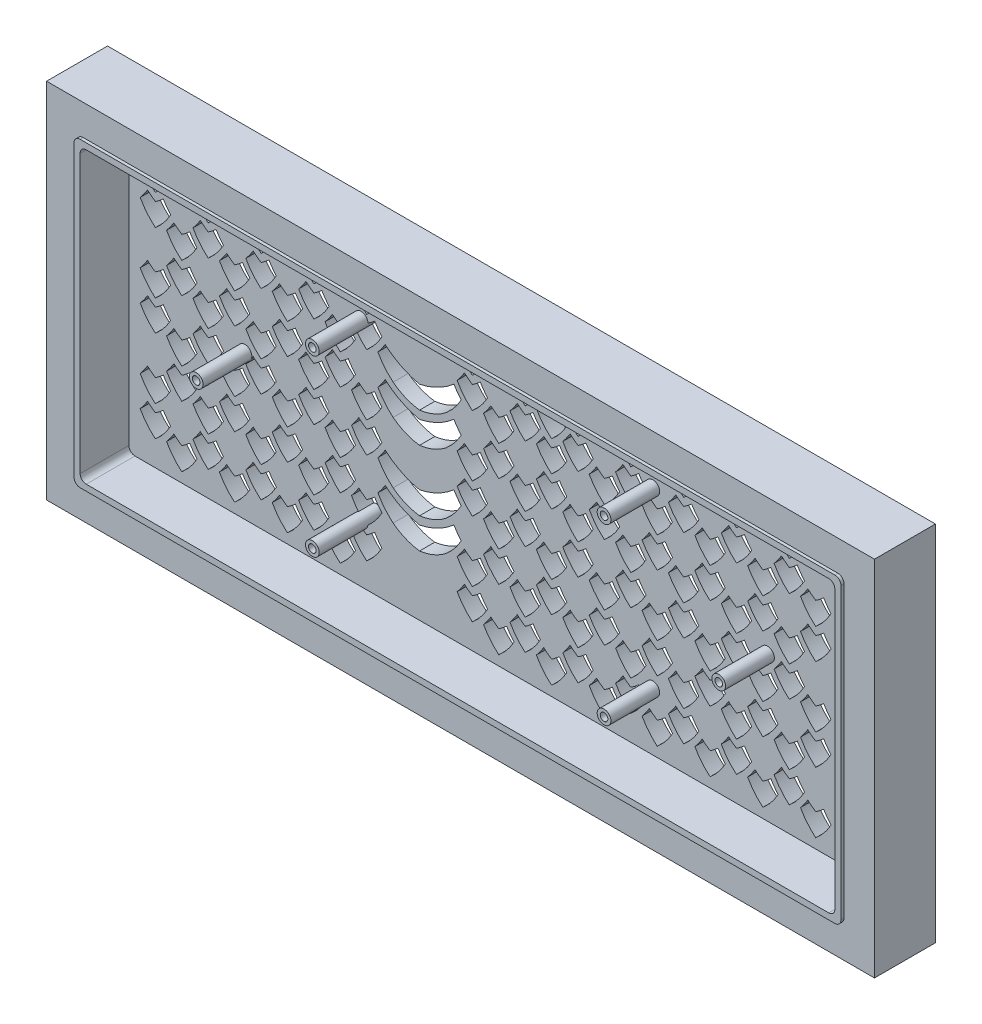
from build123d import *

# Parameters (mm, degrees)
BOSS_EXTRUDE1_DEPTH   = 5
BOSS_EXTRUDE1_2_DEPTH = 5
BOSS_EXTRUDE1_3_DEPTH = 5
SKETCH5_R             = 2.25
BOSS_EXTRUDE3_DEPTH   = 21
SKETCH6_R             = 1.25
CUT_EXTRUDE1_DEPTH    = 137.834716854
SKETCH7_W             = 271.65
SKETCH7_H             = 119.011293832
BOSS_EXTRUDE4_DEPTH   = 20


with BuildPart() as part:
    # Sketch4 → Boss-Extrude1 (new body)
    with BuildSketch(Plane.XY):
        with BuildLine():
            Line((-121.825, 47.505646916), (121.825, 47.505646916))
            ThreePointArc((121.825, 47.505646916), (123.239213562, 46.919860478), (123.825, 45.505646916))
            Line((123.825, 45.505646916), (123.825, -45.505646916))
            ThreePointArc((123.825, -45.505646916), (123.239213562, -46.919860478), (121.825, -47.505646916))
            Line((121.825, -47.505646916), (-121.825, -47.505646916))
            ThreePointArc((-121.825, -47.505646916), (-123.239213562, -46.919860478), (-123.825, -45.505646916))
            Line((-123.825, -45.505646916), (-123.825, 45.505646916))
            ThreePointArc((-123.825, 45.505646916), (-123.239213562, 46.919860478), (-121.825, 47.505646916))
        make_face()
        with BuildLine():
            ThreePointArc((-71.788991307, -44.29687171), (-74.571384393, -41.482980675), (-76.789050036, -38.205534545))
            ThreePointArc((-76.789050036, -38.205534545), (-75.516728539, -36.589271331), (-74.383121996, -34.872866666))
            ThreePointArc((-74.383121996, -34.872866666), (-73.119276048, -35.917441379), (-71.788991307, -36.875974331))
            ThreePointArc((-71.788991307, -36.875974331), (-70.458706566, -35.917441379), (-69.194860618, -34.872866666))
            ThreePointArc((-69.194860618, -34.872866666), (-68.061254075, -36.589271331), (-66.788932578, -38.205534545))
            ThreePointArc((-66.788932578, -38.205534545), (-69.006598221, -41.482980675), (-71.788991307, -44.29687171))
        make_face(mode=Mode.SUBTRACT)
        with BuildLine():
            ThreePointArc((-63.122155476, -39.29307171), (-65.904548562, -36.479180675), (-68.122214205, -33.201734545))
            ThreePointArc((-68.122214205, -33.201734545), (-66.849892708, -31.585471331), (-65.716286165, -29.869066666))
            ThreePointArc((-65.716286165, -29.869066666), (-64.452440217, -30.913641379), (-63.122155476, -31.872174331))
            ThreePointArc((-63.122155476, -31.872174331), (-61.791870735, -30.913641379), (-60.528024787, -29.869066666))
            ThreePointArc((-60.528024787, -29.869066666), (-59.394418244, -31.585471331), (-58.122096747, -33.201734545))
            ThreePointArc((-58.122096747, -33.201734545), (-60.33976239, -36.479180675), (-63.122155476, -39.29307171))
        make_face(mode=Mode.SUBTRACT)
        with BuildLine():
            ThreePointArc((-89.122662969, -44.29687171), (-91.905056055, -41.482980675), (-94.122721698, -38.205534545))
            ThreePointArc((-94.122721698, -38.205534545), (-92.850400201, -36.589271331), (-91.716793658, -34.872866666))
            ThreePointArc((-91.716793658, -34.872866666), (-90.45294771, -35.917441379), (-89.122662969, -36.875974331))
            ThreePointArc((-89.122662969, -36.875974331), (-87.792378228, -35.917441379), (-86.52853228, -34.872866666))
            ThreePointArc((-86.52853228, -34.872866666), (-85.394925737, -36.589271331), (-84.12260424, -38.205534545))
            ThreePointArc((-84.12260424, -38.205534545), (-86.340269883, -41.482980675), (-89.122662969, -44.29687171))
        make_face(mode=Mode.SUBTRACT)
        with BuildLine():
            ThreePointArc((-80.455827138, -39.29307171), (-83.238220224, -36.479180675), (-85.455885867, -33.201734545))
            ThreePointArc((-85.455885867, -33.201734545), (-84.18356437, -31.585471331), (-83.049957827, -29.869066666))
            ThreePointArc((-83.049957827, -29.869066666), (-81.786111879, -30.913641379), (-80.455827138, -31.872174331))
            ThreePointArc((-80.455827138, -31.872174331), (-79.125542397, -30.913641379), (-77.861696449, -29.869066666))
            ThreePointArc((-77.861696449, -29.869066666), (-76.728089906, -31.585471331), (-75.455768409, -33.201734545))
            ThreePointArc((-75.455768409, -33.201734545), (-77.673434052, -36.479180675), (-80.455827138, -39.29307171))
        make_face(mode=Mode.SUBTRACT)
        with BuildLine():
            ThreePointArc((-63.122155476, -29.28547171), (-65.904548562, -26.471580675), (-68.122214205, -23.194134545))
            ThreePointArc((-68.122214205, -23.194134545), (-66.849892708, -21.577871331), (-65.716286165, -19.861466666))
            ThreePointArc((-65.716286165, -19.861466666), (-64.452440217, -20.906041379), (-63.122155476, -21.864574331))
            ThreePointArc((-63.122155476, -21.864574331), (-61.791870735, -20.906041379), (-60.528024787, -19.861466666))
            ThreePointArc((-60.528024787, -19.861466666), (-59.394418244, -21.577871331), (-58.122096747, -23.194134545))
            ThreePointArc((-58.122096747, -23.194134545), (-60.33976239, -26.471580675), (-63.122155476, -29.28547171))
        make_face(mode=Mode.SUBTRACT)
        with BuildLine():
            ThreePointArc((-106.456334631, -44.29687171), (-109.238727717, -41.482980675), (-111.45639336, -38.205534545))
            ThreePointArc((-111.45639336, -38.205534545), (-110.184071863, -36.589271331), (-109.05046532, -34.872866666))
            ThreePointArc((-109.05046532, -34.872866666), (-107.786619372, -35.917441379), (-106.456334631, -36.875974331))
            ThreePointArc((-106.456334631, -36.875974331), (-105.12604989, -35.917441379), (-103.862203942, -34.872866666))
            ThreePointArc((-103.862203942, -34.872866666), (-102.728597399, -36.589271331), (-101.456275902, -38.205534545))
            ThreePointArc((-101.456275902, -38.205534545), (-103.673941545, -41.482980675), (-106.456334631, -44.29687171))
        make_face(mode=Mode.SUBTRACT)
        with BuildLine():
            ThreePointArc((-97.7894988, -39.29307171), (-100.571891886, -36.479180675), (-102.789557529, -33.201734545))
            ThreePointArc((-102.789557529, -33.201734545), (-101.517236032, -31.585471331), (-100.383629489, -29.869066666))
            ThreePointArc((-100.383629489, -29.869066666), (-99.119783541, -30.913641379), (-97.7894988, -31.872174331))
            ThreePointArc((-97.7894988, -31.872174331), (-96.459214059, -30.913641379), (-95.195368111, -29.869066666))
            ThreePointArc((-95.195368111, -29.869066666), (-94.061761568, -31.585471331), (-92.789440071, -33.201734545))
            ThreePointArc((-92.789440071, -33.201734545), (-95.007105714, -36.479180675), (-97.7894988, -39.29307171))
        make_face(mode=Mode.SUBTRACT)
        with BuildLine():
            ThreePointArc((-80.455827138, -29.28547171), (-83.238220224, -26.471580675), (-85.455885867, -23.194134545))
            ThreePointArc((-85.455885867, -23.194134545), (-84.18356437, -21.577871331), (-83.049957827, -19.861466666))
            ThreePointArc((-83.049957827, -19.861466666), (-81.786111879, -20.906041379), (-80.455827138, -21.864574331))
            ThreePointArc((-80.455827138, -21.864574331), (-79.125542397, -20.906041379), (-77.861696449, -19.861466666))
            ThreePointArc((-77.861696449, -19.861466666), (-76.728089906, -21.577871331), (-75.455768409, -23.194134545))
            ThreePointArc((-75.455768409, -23.194134545), (-77.673434052, -26.471580675), (-80.455827138, -29.28547171))
        make_face(mode=Mode.SUBTRACT)
        with BuildLine():
            ThreePointArc((-71.788991307, -24.28167171), (-74.571384393, -21.467780675), (-76.789050036, -18.190334545))
            ThreePointArc((-76.789050036, -18.190334545), (-75.516728539, -16.574071331), (-74.383121996, -14.857666666))
            ThreePointArc((-74.383121996, -14.857666666), (-73.119276048, -15.902241379), (-71.788991307, -16.860774331))
            ThreePointArc((-71.788991307, -16.860774331), (-70.458706566, -15.902241379), (-69.194860618, -14.857666666))
            ThreePointArc((-69.194860618, -14.857666666), (-68.061254075, -16.574071331), (-66.788932578, -18.190334545))
            ThreePointArc((-66.788932578, -18.190334545), (-69.006598221, -21.467780675), (-71.788991307, -24.28167171))
        make_face(mode=Mode.SUBTRACT)
        with BuildLine():
            ThreePointArc((-115.123170462, -39.29307171), (-117.905563548, -36.479180675), (-120.123229191, -33.201734545))
            ThreePointArc((-120.123229191, -33.201734545), (-118.850907694, -31.585471331), (-117.71730115, -29.869066666))
            ThreePointArc((-117.71730115, -29.869066666), (-116.453455202, -30.913641379), (-115.123170462, -31.872174331))
            ThreePointArc((-115.123170462, -31.872174331), (-113.792885721, -30.913641379), (-112.529039773, -29.869066666))
            ThreePointArc((-112.529039773, -29.869066666), (-111.395433229, -31.585471331), (-110.123111733, -33.201734545))
            ThreePointArc((-110.123111733, -33.201734545), (-112.340777376, -36.479180675), (-115.123170462, -39.29307171))
        make_face(mode=Mode.SUBTRACT)
        with BuildLine():
            ThreePointArc((-97.7894988, -29.28547171), (-100.571891886, -26.471580675), (-102.789557529, -23.194134545))
            ThreePointArc((-102.789557529, -23.194134545), (-101.517236032, -21.577871331), (-100.383629489, -19.861466666))
            ThreePointArc((-100.383629489, -19.861466666), (-99.119783541, -20.906041379), (-97.7894988, -21.864574331))
            ThreePointArc((-97.7894988, -21.864574331), (-96.459214059, -20.906041379), (-95.195368111, -19.861466666))
            ThreePointArc((-95.195368111, -19.861466666), (-94.061761568, -21.577871331), (-92.789440071, -23.194134545))
            ThreePointArc((-92.789440071, -23.194134545), (-95.007105714, -26.471580675), (-97.7894988, -29.28547171))
        make_face(mode=Mode.SUBTRACT)
        with BuildLine():
            ThreePointArc((-89.122662969, -24.28167171), (-91.905056055, -21.467780675), (-94.122721698, -18.190334545))
            ThreePointArc((-94.122721698, -18.190334545), (-92.850400201, -16.574071331), (-91.716793658, -14.857666666))
            ThreePointArc((-91.716793658, -14.857666666), (-90.45294771, -15.902241379), (-89.122662969, -16.860774331))
            ThreePointArc((-89.122662969, -16.860774331), (-87.792378228, -15.902241379), (-86.52853228, -14.857666666))
            ThreePointArc((-86.52853228, -14.857666666), (-85.394925737, -16.574071331), (-84.12260424, -18.190334545))
            ThreePointArc((-84.12260424, -18.190334545), (-86.340269883, -21.467780675), (-89.122662969, -24.28167171))
        make_face(mode=Mode.SUBTRACT)
        with BuildLine():
            ThreePointArc((-71.788991307, -14.27407171), (-74.571384393, -11.460180675), (-76.789050036, -8.182734545))
            ThreePointArc((-76.789050036, -8.182734545), (-75.516728539, -6.566471331), (-74.383121996, -4.850066666))
            ThreePointArc((-74.383121996, -4.850066666), (-73.119276048, -5.894641379), (-71.788991307, -6.853174331))
            ThreePointArc((-71.788991307, -6.853174331), (-70.458706566, -5.894641379), (-69.194860618, -4.850066666))
            ThreePointArc((-69.194860618, -4.850066666), (-68.061254075, -6.566471331), (-66.788932578, -8.182734545))
            ThreePointArc((-66.788932578, -8.182734545), (-69.006598221, -11.460180675), (-71.788991307, -14.27407171))
        make_face(mode=Mode.SUBTRACT)
        with BuildLine():
            ThreePointArc((-63.122155476, -9.27027171), (-65.904548562, -6.456380675), (-68.122214205, -3.178934545))
            ThreePointArc((-68.122214205, -3.178934545), (-66.849892708, -1.562671331), (-65.716286165, 0.153733334))
            ThreePointArc((-65.716286165, 0.153733334), (-64.452440217, -0.890841379), (-63.122155476, -1.849374331))
            ThreePointArc((-63.122155476, -1.849374331), (-61.791870735, -0.890841379), (-60.528024787, 0.153733334))
            ThreePointArc((-60.528024787, 0.153733334), (-59.394418244, -1.562671331), (-58.122096747, -3.178934545))
            ThreePointArc((-58.122096747, -3.178934545), (-60.33976239, -6.456380675), (-63.122155476, -9.27027171))
        make_face(mode=Mode.SUBTRACT)
        with BuildLine():
            ThreePointArc((-115.123170462, -29.28547171), (-117.905563548, -26.471580675), (-120.123229191, -23.194134545))
            ThreePointArc((-120.123229191, -23.194134545), (-118.850907694, -21.577871331), (-117.71730115, -19.861466666))
            ThreePointArc((-117.71730115, -19.861466666), (-116.453455202, -20.906041379), (-115.123170462, -21.864574331))
            ThreePointArc((-115.123170462, -21.864574331), (-113.792885721, -20.906041379), (-112.529039773, -19.861466666))
            ThreePointArc((-112.529039773, -19.861466666), (-111.395433229, -21.577871331), (-110.123111733, -23.194134545))
            ThreePointArc((-110.123111733, -23.194134545), (-112.340777376, -26.471580675), (-115.123170462, -29.28547171))
        make_face(mode=Mode.SUBTRACT)
        with BuildLine():
            ThreePointArc((-106.456334631, -24.28167171), (-109.238727717, -21.467780675), (-111.45639336, -18.190334545))
            ThreePointArc((-111.45639336, -18.190334545), (-110.184071863, -16.574071331), (-109.05046532, -14.857666666))
            ThreePointArc((-109.05046532, -14.857666666), (-107.786619372, -15.902241379), (-106.456334631, -16.860774331))
            ThreePointArc((-106.456334631, -16.860774331), (-105.12604989, -15.902241379), (-103.862203942, -14.857666666))
            ThreePointArc((-103.862203942, -14.857666666), (-102.728597399, -16.574071331), (-101.456275902, -18.190334545))
            ThreePointArc((-101.456275902, -18.190334545), (-103.673941545, -21.467780675), (-106.456334631, -24.28167171))
        make_face(mode=Mode.SUBTRACT)
        with BuildLine():
            ThreePointArc((-89.122662969, -14.27407171), (-91.905056055, -11.460180675), (-94.122721698, -8.182734545))
            ThreePointArc((-94.122721698, -8.182734545), (-92.850400201, -6.566471331), (-91.716793658, -4.850066666))
            ThreePointArc((-91.716793658, -4.850066666), (-90.45294771, -5.894641379), (-89.122662969, -6.853174331))
            ThreePointArc((-89.122662969, -6.853174331), (-87.792378228, -5.894641379), (-86.52853228, -4.850066666))
            ThreePointArc((-86.52853228, -4.850066666), (-85.394925737, -6.566471331), (-84.12260424, -8.182734545))
            ThreePointArc((-84.12260424, -8.182734545), (-86.340269883, -11.460180675), (-89.122662969, -14.27407171))
        make_face(mode=Mode.SUBTRACT)
        with BuildLine():
            ThreePointArc((-80.455827138, -9.27027171), (-83.238220224, -6.456380675), (-85.455885867, -3.178934545))
            ThreePointArc((-85.455885867, -3.178934545), (-84.18356437, -1.562671331), (-83.049957827, 0.153733334))
            ThreePointArc((-83.049957827, 0.153733334), (-81.786111879, -0.890841379), (-80.455827138, -1.849374331))
            ThreePointArc((-80.455827138, -1.849374331), (-79.125542397, -0.890841379), (-77.861696449, 0.153733334))
            ThreePointArc((-77.861696449, 0.153733334), (-76.728089906, -1.562671331), (-75.455768409, -3.178934545))
            ThreePointArc((-75.455768409, -3.178934545), (-77.673434052, -6.456380675), (-80.455827138, -9.27027171))
        make_face(mode=Mode.SUBTRACT)
        with BuildLine():
            ThreePointArc((-63.122155476, 0.73732829), (-65.904548562, 3.551219325), (-68.122214205, 6.828665455))
            ThreePointArc((-68.122214205, 6.828665455), (-66.849892708, 8.444928669), (-65.716286165, 10.161333334))
            ThreePointArc((-65.716286165, 10.161333334), (-64.452440217, 9.116758621), (-63.122155476, 8.158225669))
            ThreePointArc((-63.122155476, 8.158225669), (-61.791870735, 9.116758621), (-60.528024787, 10.161333334))
            ThreePointArc((-60.528024787, 10.161333334), (-59.394418244, 8.444928669), (-58.122096747, 6.828665455))
            ThreePointArc((-58.122096747, 6.828665455), (-60.33976239, 3.551219325), (-63.122155476, 0.73732829))
        make_face(mode=Mode.SUBTRACT)
        with BuildLine():
            ThreePointArc((-106.456334631, -14.27407171), (-109.238727717, -11.460180675), (-111.45639336, -8.182734545))
            ThreePointArc((-111.45639336, -8.182734545), (-110.184071863, -6.566471331), (-109.05046532, -4.850066666))
            ThreePointArc((-109.05046532, -4.850066666), (-107.786619372, -5.894641379), (-106.456334631, -6.853174331))
            ThreePointArc((-106.456334631, -6.853174331), (-105.12604989, -5.894641379), (-103.862203942, -4.850066666))
            ThreePointArc((-103.862203942, -4.850066666), (-102.728597399, -6.566471331), (-101.456275902, -8.182734545))
            ThreePointArc((-101.456275902, -8.182734545), (-103.673941545, -11.460180675), (-106.456334631, -14.27407171))
        make_face(mode=Mode.SUBTRACT)
        with BuildLine():
            ThreePointArc((-97.7894988, -9.27027171), (-100.571891886, -6.456380675), (-102.789557529, -3.178934545))
            ThreePointArc((-102.789557529, -3.178934545), (-101.517236032, -1.562671331), (-100.383629489, 0.153733334))
            ThreePointArc((-100.383629489, 0.153733334), (-99.119783541, -0.890841379), (-97.7894988, -1.849374331))
            ThreePointArc((-97.7894988, -1.849374331), (-96.459214059, -0.890841379), (-95.195368111, 0.153733334))
            ThreePointArc((-95.195368111, 0.153733334), (-94.061761568, -1.562671331), (-92.789440071, -3.178934545))
            ThreePointArc((-92.789440071, -3.178934545), (-95.007105714, -6.456380675), (-97.7894988, -9.27027171))
        make_face(mode=Mode.SUBTRACT)
        with BuildLine():
            ThreePointArc((-80.455827138, 0.73732829), (-83.238220224, 3.551219325), (-85.455885867, 6.828665455))
            ThreePointArc((-85.455885867, 6.828665455), (-84.18356437, 8.444928669), (-83.049957827, 10.161333334))
            ThreePointArc((-83.049957827, 10.161333334), (-81.786111879, 9.116758621), (-80.455827138, 8.158225669))
            ThreePointArc((-80.455827138, 8.158225669), (-79.125542397, 9.116758621), (-77.861696449, 10.161333334))
            ThreePointArc((-77.861696449, 10.161333334), (-76.728089906, 8.444928669), (-75.455768409, 6.828665455))
            ThreePointArc((-75.455768409, 6.828665455), (-77.673434052, 3.551219325), (-80.455827138, 0.73732829))
        make_face(mode=Mode.SUBTRACT)
        with BuildLine():
            ThreePointArc((-71.788991307, 5.74112829), (-74.571384393, 8.555019325), (-76.789050036, 11.832465455))
            ThreePointArc((-76.789050036, 11.832465455), (-75.516728539, 13.448728669), (-74.383121996, 15.165133334))
            ThreePointArc((-74.383121996, 15.165133334), (-73.119276048, 14.120558621), (-71.788991307, 13.162025669))
            ThreePointArc((-71.788991307, 13.162025669), (-70.458706566, 14.120558621), (-69.194860618, 15.165133334))
            ThreePointArc((-69.194860618, 15.165133334), (-68.061254075, 13.448728669), (-66.788932578, 11.832465455))
            ThreePointArc((-66.788932578, 11.832465455), (-69.006598221, 8.555019325), (-71.788991307, 5.74112829))
        make_face(mode=Mode.SUBTRACT)
        with BuildLine():
            ThreePointArc((-115.123170462, -9.27027171), (-117.905563548, -6.456380675), (-120.123229191, -3.178934545))
            ThreePointArc((-120.123229191, -3.178934545), (-118.850907694, -1.562671331), (-117.71730115, 0.153733334))
            ThreePointArc((-117.71730115, 0.153733334), (-116.453455202, -0.890841379), (-115.123170462, -1.849374331))
            ThreePointArc((-115.123170462, -1.849374331), (-113.792885721, -0.890841379), (-112.529039773, 0.153733334))
            ThreePointArc((-112.529039773, 0.153733334), (-111.395433229, -1.562671331), (-110.123111733, -3.178934545))
            ThreePointArc((-110.123111733, -3.178934545), (-112.340777376, -6.456380675), (-115.123170462, -9.27027171))
        make_face(mode=Mode.SUBTRACT)
        with BuildLine():
            ThreePointArc((-97.7894988, 0.73732829), (-100.571891886, 3.551219325), (-102.789557529, 6.828665455))
            ThreePointArc((-102.789557529, 6.828665455), (-101.517236032, 8.444928669), (-100.383629489, 10.161333334))
            ThreePointArc((-100.383629489, 10.161333334), (-99.119783541, 9.116758621), (-97.7894988, 8.158225669))
            ThreePointArc((-97.7894988, 8.158225669), (-96.459214059, 9.116758621), (-95.195368111, 10.161333334))
            ThreePointArc((-95.195368111, 10.161333334), (-94.061761568, 8.444928669), (-92.789440071, 6.828665455))
            ThreePointArc((-92.789440071, 6.828665455), (-95.007105714, 3.551219325), (-97.7894988, 0.73732829))
        make_face(mode=Mode.SUBTRACT)
        with BuildLine():
            ThreePointArc((-89.122662969, 5.74112829), (-91.905056055, 8.555019325), (-94.122721698, 11.832465455))
            ThreePointArc((-94.122721698, 11.832465455), (-92.850400201, 13.448728669), (-91.716793658, 15.165133334))
            ThreePointArc((-91.716793658, 15.165133334), (-90.45294771, 14.120558621), (-89.122662969, 13.162025669))
            ThreePointArc((-89.122662969, 13.162025669), (-87.792378228, 14.120558621), (-86.52853228, 15.165133334))
            ThreePointArc((-86.52853228, 15.165133334), (-85.394925737, 13.448728669), (-84.12260424, 11.832465455))
            ThreePointArc((-84.12260424, 11.832465455), (-86.340269883, 8.555019325), (-89.122662969, 5.74112829))
        make_face(mode=Mode.SUBTRACT)
        with BuildLine():
            ThreePointArc((-71.788991307, 15.74872829), (-74.571384393, 18.562619325), (-76.789050036, 21.840065455))
            ThreePointArc((-76.789050036, 21.840065455), (-75.516728539, 23.456328669), (-74.383121996, 25.172733334))
            ThreePointArc((-74.383121996, 25.172733334), (-73.119276048, 24.128158621), (-71.788991307, 23.169625669))
            ThreePointArc((-71.788991307, 23.169625669), (-70.458706566, 24.128158621), (-69.194860618, 25.172733334))
            ThreePointArc((-69.194860618, 25.172733334), (-68.061254075, 23.456328669), (-66.788932578, 21.840065455))
            ThreePointArc((-66.788932578, 21.840065455), (-69.006598221, 18.562619325), (-71.788991307, 15.74872829))
        make_face(mode=Mode.SUBTRACT)
        with BuildLine():
            ThreePointArc((-63.122155476, 20.75252829), (-65.904548562, 23.566419325), (-68.122214205, 26.843865455))
            ThreePointArc((-68.122214205, 26.843865455), (-66.849892708, 28.460128669), (-65.716286165, 30.176533334))
            ThreePointArc((-65.716286165, 30.176533334), (-64.452440217, 29.131958621), (-63.122155476, 28.173425669))
            ThreePointArc((-63.122155476, 28.173425669), (-61.791870735, 29.131958621), (-60.528024787, 30.176533334))
            ThreePointArc((-60.528024787, 30.176533334), (-59.394418244, 28.460128669), (-58.122096747, 26.843865455))
            ThreePointArc((-58.122096747, 26.843865455), (-60.33976239, 23.566419325), (-63.122155476, 20.75252829))
        make_face(mode=Mode.SUBTRACT)
        with BuildLine():
            ThreePointArc((-115.123170462, 0.73732829), (-117.905563548, 3.551219325), (-120.123229191, 6.828665455))
            ThreePointArc((-120.123229191, 6.828665455), (-118.850907694, 8.444928669), (-117.71730115, 10.161333334))
            ThreePointArc((-117.71730115, 10.161333334), (-116.453455202, 9.116758621), (-115.123170462, 8.158225669))
            ThreePointArc((-115.123170462, 8.158225669), (-113.792885721, 9.116758621), (-112.529039773, 10.161333334))
            ThreePointArc((-112.529039773, 10.161333334), (-111.395433229, 8.444928669), (-110.123111733, 6.828665455))
            ThreePointArc((-110.123111733, 6.828665455), (-112.340777376, 3.551219325), (-115.123170462, 0.73732829))
        make_face(mode=Mode.SUBTRACT)
        with BuildLine():
            ThreePointArc((-106.456334631, 5.74112829), (-109.238727717, 8.555019325), (-111.45639336, 11.832465455))
            ThreePointArc((-111.45639336, 11.832465455), (-110.184071863, 13.448728669), (-109.05046532, 15.165133334))
            ThreePointArc((-109.05046532, 15.165133334), (-107.786619372, 14.120558621), (-106.456334631, 13.162025669))
            ThreePointArc((-106.456334631, 13.162025669), (-105.12604989, 14.120558621), (-103.862203942, 15.165133334))
            ThreePointArc((-103.862203942, 15.165133334), (-102.728597399, 13.448728669), (-101.456275902, 11.832465455))
            ThreePointArc((-101.456275902, 11.832465455), (-103.673941545, 8.555019325), (-106.456334631, 5.74112829))
        make_face(mode=Mode.SUBTRACT)
        with BuildLine():
            ThreePointArc((-89.122662969, 15.74872829), (-91.905056055, 18.562619325), (-94.122721698, 21.840065455))
            ThreePointArc((-94.122721698, 21.840065455), (-92.850400201, 23.456328669), (-91.716793658, 25.172733334))
            ThreePointArc((-91.716793658, 25.172733334), (-90.45294771, 24.128158621), (-89.122662969, 23.169625669))
            ThreePointArc((-89.122662969, 23.169625669), (-87.792378228, 24.128158621), (-86.52853228, 25.172733334))
            ThreePointArc((-86.52853228, 25.172733334), (-85.394925737, 23.456328669), (-84.12260424, 21.840065455))
            ThreePointArc((-84.12260424, 21.840065455), (-86.340269883, 18.562619325), (-89.122662969, 15.74872829))
        make_face(mode=Mode.SUBTRACT)
        with BuildLine():
            ThreePointArc((-80.455827138, 20.75252829), (-83.238220224, 23.566419325), (-85.455885867, 26.843865455))
            ThreePointArc((-85.455885867, 26.843865455), (-84.18356437, 28.460128669), (-83.049957827, 30.176533334))
            ThreePointArc((-83.049957827, 30.176533334), (-81.786111879, 29.131958621), (-80.455827138, 28.173425669))
            ThreePointArc((-80.455827138, 28.173425669), (-79.125542397, 29.131958621), (-77.861696449, 30.176533334))
            ThreePointArc((-77.861696449, 30.176533334), (-76.728089906, 28.460128669), (-75.455768409, 26.843865455))
            ThreePointArc((-75.455768409, 26.843865455), (-77.673434052, 23.566419325), (-80.455827138, 20.75252829))
        make_face(mode=Mode.SUBTRACT)
        with BuildLine():
            ThreePointArc((-63.122155476, 30.76012829), (-65.904548562, 33.574019325), (-68.122214205, 36.851465455))
            ThreePointArc((-68.122214205, 36.851465455), (-66.849892708, 38.467728669), (-65.716286165, 40.184133334))
            ThreePointArc((-65.716286165, 40.184133334), (-64.452440217, 39.139558621), (-63.122155476, 38.181025669))
            ThreePointArc((-63.122155476, 38.181025669), (-61.791870735, 39.139558621), (-60.528024787, 40.184133334))
            ThreePointArc((-60.528024787, 40.184133334), (-59.394418244, 38.467728669), (-58.122096747, 36.851465455))
            ThreePointArc((-58.122096747, 36.851465455), (-60.33976239, 33.574019325), (-63.122155476, 30.76012829))
        make_face(mode=Mode.SUBTRACT)
        with BuildLine():
            ThreePointArc((-106.456334631, 15.74872829), (-109.238727717, 18.562619325), (-111.45639336, 21.840065455))
            ThreePointArc((-111.45639336, 21.840065455), (-110.184071863, 23.456328669), (-109.05046532, 25.172733334))
            ThreePointArc((-109.05046532, 25.172733334), (-107.786619372, 24.128158621), (-106.456334631, 23.169625669))
            ThreePointArc((-106.456334631, 23.169625669), (-105.12604989, 24.128158621), (-103.862203942, 25.172733334))
            ThreePointArc((-103.862203942, 25.172733334), (-102.728597399, 23.456328669), (-101.456275902, 21.840065455))
            ThreePointArc((-101.456275902, 21.840065455), (-103.673941545, 18.562619325), (-106.456334631, 15.74872829))
        make_face(mode=Mode.SUBTRACT)
        with BuildLine():
            ThreePointArc((-97.7894988, 20.75252829), (-100.571891886, 23.566419325), (-102.789557529, 26.843865455))
            ThreePointArc((-102.789557529, 26.843865455), (-101.517236032, 28.460128669), (-100.383629489, 30.176533334))
            ThreePointArc((-100.383629489, 30.176533334), (-99.119783541, 29.131958621), (-97.7894988, 28.173425669))
            ThreePointArc((-97.7894988, 28.173425669), (-96.459214059, 29.131958621), (-95.195368111, 30.176533334))
            ThreePointArc((-95.195368111, 30.176533334), (-94.061761568, 28.460128669), (-92.789440071, 26.843865455))
            ThreePointArc((-92.789440071, 26.843865455), (-95.007105714, 23.566419325), (-97.7894988, 20.75252829))
        make_face(mode=Mode.SUBTRACT)
        with BuildLine():
            ThreePointArc((-80.455827138, 30.76012829), (-83.238220224, 33.574019325), (-85.455885867, 36.851465455))
            ThreePointArc((-85.455885867, 36.851465455), (-84.18356437, 38.467728669), (-83.049957827, 40.184133334))
            ThreePointArc((-83.049957827, 40.184133334), (-81.786111879, 39.139558621), (-80.455827138, 38.181025669))
            ThreePointArc((-80.455827138, 38.181025669), (-79.125542397, 39.139558621), (-77.861696449, 40.184133334))
            ThreePointArc((-77.861696449, 40.184133334), (-76.728089906, 38.467728669), (-75.455768409, 36.851465455))
            ThreePointArc((-75.455768409, 36.851465455), (-77.673434052, 33.574019325), (-80.455827138, 30.76012829))
        make_face(mode=Mode.SUBTRACT)
        with BuildLine():
            ThreePointArc((-71.788991307, 35.76392829), (-74.571384393, 38.577819325), (-76.789050036, 41.855265455))
            ThreePointArc((-76.789050036, 41.855265455), (-75.516728539, 43.471528669), (-74.383121996, 45.187933334))
            ThreePointArc((-74.383121996, 45.187933334), (-73.119276048, 44.143358621), (-71.788991307, 43.184825669))
            ThreePointArc((-71.788991307, 43.184825669), (-70.458706566, 44.143358621), (-69.194860618, 45.187933334))
            ThreePointArc((-69.194860618, 45.187933334), (-68.061254075, 43.471528669), (-66.788932578, 41.855265455))
            ThreePointArc((-66.788932578, 41.855265455), (-69.006598221, 38.577819325), (-71.788991307, 35.76392829))
        make_face(mode=Mode.SUBTRACT)
        with BuildLine():
            ThreePointArc((-115.123170462, 20.75252829), (-117.905563548, 23.566419325), (-120.123229191, 26.843865455))
            ThreePointArc((-120.123229191, 26.843865455), (-118.850907694, 28.460128669), (-117.71730115, 30.176533334))
            ThreePointArc((-117.71730115, 30.176533334), (-116.453455202, 29.131958621), (-115.123170462, 28.173425669))
            ThreePointArc((-115.123170462, 28.173425669), (-113.792885721, 29.131958621), (-112.529039773, 30.176533334))
            ThreePointArc((-112.529039773, 30.176533334), (-111.395433229, 28.460128669), (-110.123111733, 26.843865455))
            ThreePointArc((-110.123111733, 26.843865455), (-112.340777376, 23.566419325), (-115.123170462, 20.75252829))
        make_face(mode=Mode.SUBTRACT)
        with BuildLine():
            ThreePointArc((-97.7894988, 30.76012829), (-100.571891886, 33.574019325), (-102.789557529, 36.851465455))
            ThreePointArc((-102.789557529, 36.851465455), (-101.517236032, 38.467728669), (-100.383629489, 40.184133334))
            ThreePointArc((-100.383629489, 40.184133334), (-99.119783541, 39.139558621), (-97.7894988, 38.181025669))
            ThreePointArc((-97.7894988, 38.181025669), (-96.459214059, 39.139558621), (-95.195368111, 40.184133334))
            ThreePointArc((-95.195368111, 40.184133334), (-94.061761568, 38.467728669), (-92.789440071, 36.851465455))
            ThreePointArc((-92.789440071, 36.851465455), (-95.007105714, 33.574019325), (-97.7894988, 30.76012829))
        make_face(mode=Mode.SUBTRACT)
        with BuildLine():
            ThreePointArc((-89.122662969, 35.76392829), (-91.905056055, 38.577819325), (-94.122721698, 41.855265455))
            ThreePointArc((-94.122721698, 41.855265455), (-92.850400201, 43.471528669), (-91.716793658, 45.187933334))
            ThreePointArc((-91.716793658, 45.187933334), (-90.45294771, 44.143358621), (-89.122662969, 43.184825669))
            ThreePointArc((-89.122662969, 43.184825669), (-87.792378228, 44.143358621), (-86.52853228, 45.187933334))
            ThreePointArc((-86.52853228, 45.187933334), (-85.394925737, 43.471528669), (-84.12260424, 41.855265455))
            ThreePointArc((-84.12260424, 41.855265455), (-86.340269883, 38.577819325), (-89.122662969, 35.76392829))
        make_face(mode=Mode.SUBTRACT)
        with BuildLine():
            ThreePointArc((-115.123170462, 30.76012829), (-117.905563548, 33.574019325), (-120.123229191, 36.851465455))
            ThreePointArc((-120.123229191, 36.851465455), (-118.850907694, 38.467728669), (-117.71730115, 40.184133334))
            ThreePointArc((-117.71730115, 40.184133334), (-116.453455202, 39.139558621), (-115.123170462, 38.181025669))
            ThreePointArc((-115.123170462, 38.181025669), (-113.792885721, 39.139558621), (-112.529039773, 40.184133334))
            ThreePointArc((-112.529039773, 40.184133334), (-111.395433229, 38.467728669), (-110.123111733, 36.851465455))
            ThreePointArc((-110.123111733, 36.851465455), (-112.340777376, 33.574019325), (-115.123170462, 30.76012829))
        make_face(mode=Mode.SUBTRACT)
        with BuildLine():
            ThreePointArc((-106.456334631, 35.76392829), (-109.238727717, 38.577819325), (-111.45639336, 41.855265455))
            ThreePointArc((-111.45639336, 41.855265455), (-110.184071863, 43.471528669), (-109.05046532, 45.187933334))
            ThreePointArc((-109.05046532, 45.187933334), (-107.786619372, 44.143358621), (-106.456334631, 43.184825669))
            ThreePointArc((-106.456334631, 43.184825669), (-105.12604989, 44.143358621), (-103.862203942, 45.187933334))
            ThreePointArc((-103.862203942, 45.187933334), (-102.728597399, 43.471528669), (-101.456275902, 41.855265455))
            ThreePointArc((-101.456275902, 41.855265455), (-103.673941545, 38.577819325), (-106.456334631, 35.76392829))
        make_face(mode=Mode.SUBTRACT)
        with BuildLine():
            ThreePointArc((66.880381987, -44.29687171), (64.097988902, -41.482980675), (61.880323258, -38.205534545))
            ThreePointArc((61.880323258, -38.205534545), (63.152644755, -36.589271331), (64.286251299, -34.872866666))
            ThreePointArc((64.286251299, -34.872866666), (65.550097247, -35.917441379), (66.880381987, -36.875974331))
            ThreePointArc((66.880381987, -36.875974331), (68.210666728, -35.917441379), (69.474512676, -34.872866666))
            ThreePointArc((69.474512676, -34.872866666), (70.60811922, -36.589271331), (71.880440717, -38.205534545))
            ThreePointArc((71.880440717, -38.205534545), (69.662775073, -41.482980675), (66.880381987, -44.29687171))
        make_face(mode=Mode.SUBTRACT)
        with BuildLine():
            ThreePointArc((75.547217818, -39.29307171), (72.764824732, -36.479180675), (70.547159089, -33.201734545))
            ThreePointArc((70.547159089, -33.201734545), (71.819480586, -31.585471331), (72.95308713, -29.869066666))
            ThreePointArc((72.95308713, -29.869066666), (74.216933078, -30.913641379), (75.547217818, -31.872174331))
            ThreePointArc((75.547217818, -31.872174331), (76.877502559, -30.913641379), (78.141348507, -29.869066666))
            ThreePointArc((78.141348507, -29.869066666), (79.274955051, -31.585471331), (80.547276548, -33.201734545))
            ThreePointArc((80.547276548, -33.201734545), (78.329610904, -36.479180675), (75.547217818, -39.29307171))
        make_face(mode=Mode.SUBTRACT)
        with BuildLine():
            ThreePointArc((49.546710326, -44.29687171), (46.76431724, -41.482980675), (44.546651597, -38.205534545))
            ThreePointArc((44.546651597, -38.205534545), (45.818973093, -36.589271331), (46.952579637, -34.872866666))
            ThreePointArc((46.952579637, -34.872866666), (48.216425585, -35.917441379), (49.546710326, -36.875974331))
            ThreePointArc((49.546710326, -36.875974331), (50.876995066, -35.917441379), (52.140841014, -34.872866666))
            ThreePointArc((52.140841014, -34.872866666), (53.274447558, -36.589271331), (54.546769055, -38.205534545))
            ThreePointArc((54.546769055, -38.205534545), (52.329103412, -41.482980675), (49.546710326, -44.29687171))
        make_face(mode=Mode.SUBTRACT)
        with BuildLine():
            ThreePointArc((58.213546157, -39.29307171), (55.431153071, -36.479180675), (53.213487427, -33.201734545))
            ThreePointArc((53.213487427, -33.201734545), (54.485808924, -31.585471331), (55.619415468, -29.869066666))
            ThreePointArc((55.619415468, -29.869066666), (56.883261416, -30.913641379), (58.213546157, -31.872174331))
            ThreePointArc((58.213546157, -31.872174331), (59.543830897, -30.913641379), (60.807676845, -29.869066666))
            ThreePointArc((60.807676845, -29.869066666), (61.941283389, -31.585471331), (63.213604886, -33.201734545))
            ThreePointArc((63.213604886, -33.201734545), (60.995939243, -36.479180675), (58.213546157, -39.29307171))
        make_face(mode=Mode.SUBTRACT)
        with BuildLine():
            ThreePointArc((75.547217818, -29.28547171), (72.764824732, -26.471580675), (70.547159089, -23.194134545))
            ThreePointArc((70.547159089, -23.194134545), (71.819480586, -21.577871331), (72.95308713, -19.861466666))
            ThreePointArc((72.95308713, -19.861466666), (74.216933078, -20.906041379), (75.547217818, -21.864574331))
            ThreePointArc((75.547217818, -21.864574331), (76.877502559, -20.906041379), (78.141348507, -19.861466666))
            ThreePointArc((78.141348507, -19.861466666), (79.274955051, -21.577871331), (80.547276548, -23.194134545))
            ThreePointArc((80.547276548, -23.194134545), (78.329610904, -26.471580675), (75.547217818, -29.28547171))
        make_face(mode=Mode.SUBTRACT)
        with BuildLine():
            ThreePointArc((32.213038664, -44.29687171), (29.430645578, -41.482980675), (27.212979935, -38.205534545))
            ThreePointArc((27.212979935, -38.205534545), (28.485301432, -36.589271331), (29.618907975, -34.872866666))
            ThreePointArc((29.618907975, -34.872866666), (30.882753923, -35.917441379), (32.213038664, -36.875974331))
            ThreePointArc((32.213038664, -36.875974331), (33.543323405, -35.917441379), (34.807169353, -34.872866666))
            ThreePointArc((34.807169353, -34.872866666), (35.940775896, -36.589271331), (37.213097393, -38.205534545))
            ThreePointArc((37.213097393, -38.205534545), (34.99543175, -41.482980675), (32.213038664, -44.29687171))
        make_face(mode=Mode.SUBTRACT)
        with BuildLine():
            ThreePointArc((40.879874495, -39.29307171), (38.097481409, -36.479180675), (35.879815766, -33.201734545))
            ThreePointArc((35.879815766, -33.201734545), (37.152137262, -31.585471331), (38.285743806, -29.869066666))
            ThreePointArc((38.285743806, -29.869066666), (39.549589754, -30.913641379), (40.879874495, -31.872174331))
            ThreePointArc((40.879874495, -31.872174331), (42.210159236, -30.913641379), (43.474005184, -29.869066666))
            ThreePointArc((43.474005184, -29.869066666), (44.607611727, -31.585471331), (45.879933224, -33.201734545))
            ThreePointArc((45.879933224, -33.201734545), (43.662267581, -36.479180675), (40.879874495, -39.29307171))
        make_face(mode=Mode.SUBTRACT)
        with BuildLine():
            ThreePointArc((58.213546157, -29.28547171), (55.431153071, -26.471580675), (53.213487427, -23.194134545))
            ThreePointArc((53.213487427, -23.194134545), (54.485808924, -21.577871331), (55.619415468, -19.861466666))
            ThreePointArc((55.619415468, -19.861466666), (56.883261416, -20.906041379), (58.213546157, -21.864574331))
            ThreePointArc((58.213546157, -21.864574331), (59.543830897, -20.906041379), (60.807676845, -19.861466666))
            ThreePointArc((60.807676845, -19.861466666), (61.941283389, -21.577871331), (63.213604886, -23.194134545))
            ThreePointArc((63.213604886, -23.194134545), (60.995939243, -26.471580675), (58.213546157, -29.28547171))
        make_face(mode=Mode.SUBTRACT)
        with BuildLine():
            ThreePointArc((66.880381987, -24.28167171), (64.097988902, -21.467780675), (61.880323258, -18.190334545))
            ThreePointArc((61.880323258, -18.190334545), (63.152644755, -16.574071331), (64.286251299, -14.857666666))
            ThreePointArc((64.286251299, -14.857666666), (65.550097247, -15.902241379), (66.880381987, -16.860774331))
            ThreePointArc((66.880381987, -16.860774331), (68.210666728, -15.902241379), (69.474512676, -14.857666666))
            ThreePointArc((69.474512676, -14.857666666), (70.60811922, -16.574071331), (71.880440717, -18.190334545))
            ThreePointArc((71.880440717, -18.190334545), (69.662775073, -21.467780675), (66.880381987, -24.28167171))
        make_face(mode=Mode.SUBTRACT)
        with BuildLine():
            ThreePointArc((14.879367002, -44.29687171), (12.096973916, -41.482980675), (9.879308273, -38.205534545))
            ThreePointArc((9.879308273, -38.205534545), (11.15162977, -36.589271331), (12.285236313, -34.872866666))
            ThreePointArc((12.285236313, -34.872866666), (13.549082261, -35.917441379), (14.879367002, -36.875974331))
            ThreePointArc((14.879367002, -36.875974331), (16.209651743, -35.917441379), (17.473497691, -34.872866666))
            ThreePointArc((17.473497691, -34.872866666), (18.607104234, -36.589271331), (19.879425731, -38.205534545))
            ThreePointArc((19.879425731, -38.205534545), (17.661760088, -41.482980675), (14.879367002, -44.29687171))
        make_face(mode=Mode.SUBTRACT)
        with BuildLine():
            ThreePointArc((23.546202833, -39.29307171), (20.763809747, -36.479180675), (18.546144104, -33.201734545))
            ThreePointArc((18.546144104, -33.201734545), (19.818465601, -31.585471331), (20.952072144, -29.869066666))
            ThreePointArc((20.952072144, -29.869066666), (22.215918092, -30.913641379), (23.546202833, -31.872174331))
            ThreePointArc((23.546202833, -31.872174331), (24.876487574, -30.913641379), (26.140333522, -29.869066666))
            ThreePointArc((26.140333522, -29.869066666), (27.273940065, -31.585471331), (28.546261562, -33.201734545))
            ThreePointArc((28.546261562, -33.201734545), (26.328595919, -36.479180675), (23.546202833, -39.29307171))
        make_face(mode=Mode.SUBTRACT)
        with BuildLine():
            ThreePointArc((40.879874495, -29.28547171), (38.097481409, -26.471580675), (35.879815766, -23.194134545))
            ThreePointArc((35.879815766, -23.194134545), (37.152137262, -21.577871331), (38.285743806, -19.861466666))
            ThreePointArc((38.285743806, -19.861466666), (39.549589754, -20.906041379), (40.879874495, -21.864574331))
            ThreePointArc((40.879874495, -21.864574331), (42.210159236, -20.906041379), (43.474005184, -19.861466666))
            ThreePointArc((43.474005184, -19.861466666), (44.607611727, -21.577871331), (45.879933224, -23.194134545))
            ThreePointArc((45.879933224, -23.194134545), (43.662267581, -26.471580675), (40.879874495, -29.28547171))
        make_face(mode=Mode.SUBTRACT)
        with BuildLine():
            ThreePointArc((49.546710326, -24.28167171), (46.76431724, -21.467780675), (44.546651597, -18.190334545))
            ThreePointArc((44.546651597, -18.190334545), (45.818973093, -16.574071331), (46.952579637, -14.857666666))
            ThreePointArc((46.952579637, -14.857666666), (48.216425585, -15.902241379), (49.546710326, -16.860774331))
            ThreePointArc((49.546710326, -16.860774331), (50.876995066, -15.902241379), (52.140841014, -14.857666666))
            ThreePointArc((52.140841014, -14.857666666), (53.274447558, -16.574071331), (54.546769055, -18.190334545))
            ThreePointArc((54.546769055, -18.190334545), (52.329103412, -21.467780675), (49.546710326, -24.28167171))
        make_face(mode=Mode.SUBTRACT)
        with BuildLine():
            ThreePointArc((66.880381987, -14.27407171), (64.097988902, -11.460180675), (61.880323258, -8.182734545))
            ThreePointArc((61.880323258, -8.182734545), (63.152644755, -6.566471331), (64.286251299, -4.850066666))
            ThreePointArc((64.286251299, -4.850066666), (65.550097247, -5.894641379), (66.880381987, -6.853174331))
            ThreePointArc((66.880381987, -6.853174331), (68.210666728, -5.894641379), (69.474512676, -4.850066666))
            ThreePointArc((69.474512676, -4.850066666), (70.60811922, -6.566471331), (71.880440717, -8.182734545))
            ThreePointArc((71.880440717, -8.182734545), (69.662775073, -11.460180675), (66.880381987, -14.27407171))
        make_face(mode=Mode.SUBTRACT)
        with BuildLine():
            ThreePointArc((75.547217818, -9.27027171), (72.764824732, -6.456380675), (70.547159089, -3.178934545))
            ThreePointArc((70.547159089, -3.178934545), (71.819480586, -1.562671331), (72.95308713, 0.153733334))
            ThreePointArc((72.95308713, 0.153733334), (74.216933078, -0.890841379), (75.547217818, -1.849374331))
            ThreePointArc((75.547217818, -1.849374331), (76.877502559, -0.890841379), (78.141348507, 0.153733334))
            ThreePointArc((78.141348507, 0.153733334), (79.274955051, -1.562671331), (80.547276548, -3.178934545))
            ThreePointArc((80.547276548, -3.178934545), (78.329610904, -6.456380675), (75.547217818, -9.27027171))
        make_face(mode=Mode.SUBTRACT)
        with BuildLine():
            ThreePointArc((-2.45430466, -44.29687171), (-5.236697746, -41.482980675), (-7.454363389, -38.205534545))
            ThreePointArc((-7.454363389, -38.205534545), (-6.182041892, -36.589271331), (-5.048435349, -34.872866666))
            ThreePointArc((-5.048435349, -34.872866666), (-3.784589401, -35.917441379), (-2.45430466, -36.875974331))
            ThreePointArc((-2.45430466, -36.875974331), (-1.124019919, -35.917441379), (0.139826029, -34.872866666))
            ThreePointArc((0.139826029, -34.872866666), (1.273432572, -36.589271331), (2.545754069, -38.205534545))
            ThreePointArc((2.545754069, -38.205534545), (0.328088426, -41.482980675), (-2.45430466, -44.29687171))
        make_face(mode=Mode.SUBTRACT)
        with BuildLine():
            ThreePointArc((6.212531171, -39.29307171), (3.430138085, -36.479180675), (1.212472442, -33.201734545))
            ThreePointArc((1.212472442, -33.201734545), (2.484793939, -31.585471331), (3.618400482, -29.869066666))
            ThreePointArc((3.618400482, -29.869066666), (4.88224643, -30.913641379), (6.212531171, -31.872174331))
            ThreePointArc((6.212531171, -31.872174331), (7.542815912, -30.913641379), (8.80666186, -29.869066666))
            ThreePointArc((8.80666186, -29.869066666), (9.940268403, -31.585471331), (11.2125899, -33.201734545))
            ThreePointArc((11.2125899, -33.201734545), (8.994924257, -36.479180675), (6.212531171, -39.29307171))
        make_face(mode=Mode.SUBTRACT)
        with BuildLine():
            ThreePointArc((23.546202833, -29.28547171), (20.763809747, -26.471580675), (18.546144104, -23.194134545))
            ThreePointArc((18.546144104, -23.194134545), (19.818465601, -21.577871331), (20.952072144, -19.861466666))
            ThreePointArc((20.952072144, -19.861466666), (22.215918092, -20.906041379), (23.546202833, -21.864574331))
            ThreePointArc((23.546202833, -21.864574331), (24.876487574, -20.906041379), (26.140333522, -19.861466666))
            ThreePointArc((26.140333522, -19.861466666), (27.273940065, -21.577871331), (28.546261562, -23.194134545))
            ThreePointArc((28.546261562, -23.194134545), (26.328595919, -26.471580675), (23.546202833, -29.28547171))
        make_face(mode=Mode.SUBTRACT)
        with BuildLine():
            ThreePointArc((32.213038664, -24.28167171), (29.430645578, -21.467780675), (27.212979935, -18.190334545))
            ThreePointArc((27.212979935, -18.190334545), (28.485301432, -16.574071331), (29.618907975, -14.857666666))
            ThreePointArc((29.618907975, -14.857666666), (30.882753923, -15.902241379), (32.213038664, -16.860774331))
            ThreePointArc((32.213038664, -16.860774331), (33.543323405, -15.902241379), (34.807169353, -14.857666666))
            ThreePointArc((34.807169353, -14.857666666), (35.940775896, -16.574071331), (37.213097393, -18.190334545))
            ThreePointArc((37.213097393, -18.190334545), (34.99543175, -21.467780675), (32.213038664, -24.28167171))
        make_face(mode=Mode.SUBTRACT)
        with BuildLine():
            ThreePointArc((49.546710326, -14.27407171), (46.76431724, -11.460180675), (44.546651597, -8.182734545))
            ThreePointArc((44.546651597, -8.182734545), (45.818973093, -6.566471331), (46.952579637, -4.850066666))
            ThreePointArc((46.952579637, -4.850066666), (48.216425585, -5.894641379), (49.546710326, -6.853174331))
            ThreePointArc((49.546710326, -6.853174331), (50.876995066, -5.894641379), (52.140841014, -4.850066666))
            ThreePointArc((52.140841014, -4.850066666), (53.274447558, -6.566471331), (54.546769055, -8.182734545))
            ThreePointArc((54.546769055, -8.182734545), (52.329103412, -11.460180675), (49.546710326, -14.27407171))
        make_face(mode=Mode.SUBTRACT)
        with BuildLine():
            ThreePointArc((58.213546157, -9.27027171), (55.431153071, -6.456380675), (53.213487427, -3.178934545))
            ThreePointArc((53.213487427, -3.178934545), (54.485808924, -1.562671331), (55.619415468, 0.153733334))
            ThreePointArc((55.619415468, 0.153733334), (56.883261416, -0.890841379), (58.213546157, -1.849374331))
            ThreePointArc((58.213546157, -1.849374331), (59.543830897, -0.890841379), (60.807676845, 0.153733334))
            ThreePointArc((60.807676845, 0.153733334), (61.941283389, -1.562671331), (63.213604886, -3.178934545))
            ThreePointArc((63.213604886, -3.178934545), (60.995939243, -6.456380675), (58.213546157, -9.27027171))
        make_face(mode=Mode.SUBTRACT)
        with BuildLine():
            ThreePointArc((75.547217818, 0.73732829), (72.764824732, 3.551219325), (70.547159089, 6.828665455))
            ThreePointArc((70.547159089, 6.828665455), (71.819480586, 8.444928669), (72.95308713, 10.161333334))
            ThreePointArc((72.95308713, 10.161333334), (74.216933078, 9.116758621), (75.547217818, 8.158225669))
            ThreePointArc((75.547217818, 8.158225669), (76.877502559, 9.116758621), (78.141348507, 10.161333334))
            ThreePointArc((78.141348507, 10.161333334), (79.274955051, 8.444928669), (80.547276548, 6.828665455))
            ThreePointArc((80.547276548, 6.828665455), (78.329610904, 3.551219325), (75.547217818, 0.73732829))
        make_face(mode=Mode.SUBTRACT)
        with BuildLine():
            ThreePointArc((-11.121140491, -39.29307171), (-13.903533577, -36.479180675), (-16.12119922, -33.201734545))
            ThreePointArc((-16.12119922, -33.201734545), (-14.848877723, -31.585471331), (-13.715271179, -29.869066666))
            ThreePointArc((-13.715271179, -29.869066666), (-12.451425232, -30.913641379), (-11.121140491, -31.872174331))
            ThreePointArc((-11.121140491, -31.872174331), (-9.79085575, -30.913641379), (-8.527009802, -29.869066666))
            ThreePointArc((-8.527009802, -29.869066666), (-7.393403258, -31.585471331), (-6.121081762, -33.201734545))
            ThreePointArc((-6.121081762, -33.201734545), (-8.338747405, -36.479180675), (-11.121140491, -39.29307171))
        make_face(mode=Mode.SUBTRACT)
        with BuildLine():
            ThreePointArc((6.212531171, -29.28547171), (3.430138085, -26.471580675), (1.212472442, -23.194134545))
            ThreePointArc((1.212472442, -23.194134545), (2.484793939, -21.577871331), (3.618400482, -19.861466666))
            ThreePointArc((3.618400482, -19.861466666), (4.88224643, -20.906041379), (6.212531171, -21.864574331))
            ThreePointArc((6.212531171, -21.864574331), (7.542815912, -20.906041379), (8.80666186, -19.861466666))
            ThreePointArc((8.80666186, -19.861466666), (9.940268403, -21.577871331), (11.2125899, -23.194134545))
            ThreePointArc((11.2125899, -23.194134545), (8.994924257, -26.471580675), (6.212531171, -29.28547171))
        make_face(mode=Mode.SUBTRACT)
        with BuildLine():
            ThreePointArc((14.879367002, -24.28167171), (12.096973916, -21.467780675), (9.879308273, -18.190334545))
            ThreePointArc((9.879308273, -18.190334545), (11.15162977, -16.574071331), (12.285236313, -14.857666666))
            ThreePointArc((12.285236313, -14.857666666), (13.549082261, -15.902241379), (14.879367002, -16.860774331))
            ThreePointArc((14.879367002, -16.860774331), (16.209651743, -15.902241379), (17.473497691, -14.857666666))
            ThreePointArc((17.473497691, -14.857666666), (18.607104234, -16.574071331), (19.879425731, -18.190334545))
            ThreePointArc((19.879425731, -18.190334545), (17.661760088, -21.467780675), (14.879367002, -24.28167171))
        make_face(mode=Mode.SUBTRACT)
        with BuildLine():
            ThreePointArc((32.213038664, -14.27407171), (29.430645578, -11.460180675), (27.212979935, -8.182734545))
            ThreePointArc((27.212979935, -8.182734545), (28.485301432, -6.566471331), (29.618907975, -4.850066666))
            ThreePointArc((29.618907975, -4.850066666), (30.882753923, -5.894641379), (32.213038664, -6.853174331))
            ThreePointArc((32.213038664, -6.853174331), (33.543323405, -5.894641379), (34.807169353, -4.850066666))
            ThreePointArc((34.807169353, -4.850066666), (35.940775896, -6.566471331), (37.213097393, -8.182734545))
            ThreePointArc((37.213097393, -8.182734545), (34.99543175, -11.460180675), (32.213038664, -14.27407171))
        make_face(mode=Mode.SUBTRACT)
        with BuildLine():
            ThreePointArc((40.879874495, -9.27027171), (38.097481409, -6.456380675), (35.879815766, -3.178934545))
            ThreePointArc((35.879815766, -3.178934545), (37.152137262, -1.562671331), (38.285743806, 0.153733334))
            ThreePointArc((38.285743806, 0.153733334), (39.549589754, -0.890841379), (40.879874495, -1.849374331))
            ThreePointArc((40.879874495, -1.849374331), (42.210159236, -0.890841379), (43.474005184, 0.153733334))
            ThreePointArc((43.474005184, 0.153733334), (44.607611727, -1.562671331), (45.879933224, -3.178934545))
            ThreePointArc((45.879933224, -3.178934545), (43.662267581, -6.456380675), (40.879874495, -9.27027171))
        make_face(mode=Mode.SUBTRACT)
        with BuildLine():
            ThreePointArc((58.213546157, 0.73732829), (55.431153071, 3.551219325), (53.213487427, 6.828665455))
            ThreePointArc((53.213487427, 6.828665455), (54.485808924, 8.444928669), (55.619415468, 10.161333334))
            ThreePointArc((55.619415468, 10.161333334), (56.883261416, 9.116758621), (58.213546157, 8.158225669))
            ThreePointArc((58.213546157, 8.158225669), (59.543830897, 9.116758621), (60.807676845, 10.161333334))
            ThreePointArc((60.807676845, 10.161333334), (61.941283389, 8.444928669), (63.213604886, 6.828665455))
            ThreePointArc((63.213604886, 6.828665455), (60.995939243, 3.551219325), (58.213546157, 0.73732829))
        make_face(mode=Mode.SUBTRACT)
        with BuildLine():
            ThreePointArc((66.880381987, 5.74112829), (64.097988902, 8.555019325), (61.880323258, 11.832465455))
            ThreePointArc((61.880323258, 11.832465455), (63.152644755, 13.448728669), (64.286251299, 15.165133334))
            ThreePointArc((64.286251299, 15.165133334), (65.550097247, 14.120558621), (66.880381987, 13.162025669))
            ThreePointArc((66.880381987, 13.162025669), (68.210666728, 14.120558621), (69.474512676, 15.165133334))
            ThreePointArc((69.474512676, 15.165133334), (70.60811922, 13.448728669), (71.880440717, 11.832465455))
            ThreePointArc((71.880440717, 11.832465455), (69.662775073, 8.555019325), (66.880381987, 5.74112829))
        make_face(mode=Mode.SUBTRACT)
        with BuildLine():
            ThreePointArc((-11.121140491, -29.28547171), (-13.903533577, -26.471580675), (-16.12119922, -23.194134545))
            ThreePointArc((-16.12119922, -23.194134545), (-14.848877723, -21.577871331), (-13.715271179, -19.861466666))
            ThreePointArc((-13.715271179, -19.861466666), (-12.451425232, -20.906041379), (-11.121140491, -21.864574331))
            ThreePointArc((-11.121140491, -21.864574331), (-9.79085575, -20.906041379), (-8.527009802, -19.861466666))
            ThreePointArc((-8.527009802, -19.861466666), (-7.393403258, -21.577871331), (-6.121081762, -23.194134545))
            ThreePointArc((-6.121081762, -23.194134545), (-8.338747405, -26.471580675), (-11.121140491, -29.28547171))
        make_face(mode=Mode.SUBTRACT)
        with BuildLine():
            ThreePointArc((-2.45430466, -24.28167171), (-5.236697746, -21.467780675), (-7.454363389, -18.190334545))
            ThreePointArc((-7.454363389, -18.190334545), (-6.182041892, -16.574071331), (-5.048435349, -14.857666666))
            ThreePointArc((-5.048435349, -14.857666666), (-3.784589401, -15.902241379), (-2.45430466, -16.860774331))
            ThreePointArc((-2.45430466, -16.860774331), (-1.124019919, -15.902241379), (0.139826029, -14.857666666))
            ThreePointArc((0.139826029, -14.857666666), (1.273432572, -16.574071331), (2.545754069, -18.190334545))
            ThreePointArc((2.545754069, -18.190334545), (0.328088426, -21.467780675), (-2.45430466, -24.28167171))
        make_face(mode=Mode.SUBTRACT)
        with BuildLine():
            ThreePointArc((14.879367002, -14.27407171), (12.096973916, -11.460180675), (9.879308273, -8.182734545))
            ThreePointArc((9.879308273, -8.182734545), (11.15162977, -6.566471331), (12.285236313, -4.850066666))
            ThreePointArc((12.285236313, -4.850066666), (13.549082261, -5.894641379), (14.879367002, -6.853174331))
            ThreePointArc((14.879367002, -6.853174331), (16.209651743, -5.894641379), (17.473497691, -4.850066666))
            ThreePointArc((17.473497691, -4.850066666), (18.607104234, -6.566471331), (19.879425731, -8.182734545))
            ThreePointArc((19.879425731, -8.182734545), (17.661760088, -11.460180675), (14.879367002, -14.27407171))
        make_face(mode=Mode.SUBTRACT)
        with BuildLine():
            ThreePointArc((23.546202833, -9.27027171), (20.763809747, -6.456380675), (18.546144104, -3.178934545))
            ThreePointArc((18.546144104, -3.178934545), (19.818465601, -1.562671331), (20.952072144, 0.153733334))
            ThreePointArc((20.952072144, 0.153733334), (22.215918092, -0.890841379), (23.546202833, -1.849374331))
            ThreePointArc((23.546202833, -1.849374331), (24.876487574, -0.890841379), (26.140333522, 0.153733334))
            ThreePointArc((26.140333522, 0.153733334), (27.273940065, -1.562671331), (28.546261562, -3.178934545))
            ThreePointArc((28.546261562, -3.178934545), (26.328595919, -6.456380675), (23.546202833, -9.27027171))
        make_face(mode=Mode.SUBTRACT)
        with BuildLine():
            ThreePointArc((40.879874495, 0.73732829), (38.097481409, 3.551219325), (35.879815766, 6.828665455))
            ThreePointArc((35.879815766, 6.828665455), (37.152137262, 8.444928669), (38.285743806, 10.161333334))
            ThreePointArc((38.285743806, 10.161333334), (39.549589754, 9.116758621), (40.879874495, 8.158225669))
            ThreePointArc((40.879874495, 8.158225669), (42.210159236, 9.116758621), (43.474005184, 10.161333334))
            ThreePointArc((43.474005184, 10.161333334), (44.607611727, 8.444928669), (45.879933224, 6.828665455))
            ThreePointArc((45.879933224, 6.828665455), (43.662267581, 3.551219325), (40.879874495, 0.73732829))
        make_face(mode=Mode.SUBTRACT)
        with BuildLine():
            ThreePointArc((49.546710326, 5.74112829), (46.76431724, 8.555019325), (44.546651597, 11.832465455))
            ThreePointArc((44.546651597, 11.832465455), (45.818973093, 13.448728669), (46.952579637, 15.165133334))
            ThreePointArc((46.952579637, 15.165133334), (48.216425585, 14.120558621), (49.546710326, 13.162025669))
            ThreePointArc((49.546710326, 13.162025669), (50.876995066, 14.120558621), (52.140841014, 15.165133334))
            ThreePointArc((52.140841014, 15.165133334), (53.274447558, 13.448728669), (54.546769055, 11.832465455))
            ThreePointArc((54.546769055, 11.832465455), (52.329103412, 8.555019325), (49.546710326, 5.74112829))
        make_face(mode=Mode.SUBTRACT)
        with BuildLine():
            ThreePointArc((66.880381987, 15.74872829), (64.097988902, 18.562619325), (61.880323258, 21.840065455))
            ThreePointArc((61.880323258, 21.840065455), (63.152644755, 23.456328669), (64.286251299, 25.172733334))
            ThreePointArc((64.286251299, 25.172733334), (65.550097247, 24.128158621), (66.880381987, 23.169625669))
            ThreePointArc((66.880381987, 23.169625669), (68.210666728, 24.128158621), (69.474512676, 25.172733334))
            ThreePointArc((69.474512676, 25.172733334), (70.60811922, 23.456328669), (71.880440717, 21.840065455))
            ThreePointArc((71.880440717, 21.840065455), (69.662775073, 18.562619325), (66.880381987, 15.74872829))
        make_face(mode=Mode.SUBTRACT)
        with BuildLine():
            ThreePointArc((75.547217818, 20.75252829), (72.764824732, 23.566419325), (70.547159089, 26.843865455))
            ThreePointArc((70.547159089, 26.843865455), (71.819480586, 28.460128669), (72.95308713, 30.176533334))
            ThreePointArc((72.95308713, 30.176533334), (74.216933078, 29.131958621), (75.547217818, 28.173425669))
            ThreePointArc((75.547217818, 28.173425669), (76.877502559, 29.131958621), (78.141348507, 30.176533334))
            ThreePointArc((78.141348507, 30.176533334), (79.274955051, 28.460128669), (80.547276548, 26.843865455))
            ThreePointArc((80.547276548, 26.843865455), (78.329610904, 23.566419325), (75.547217818, 20.75252829))
        make_face(mode=Mode.SUBTRACT)
        with BuildLine():
            ThreePointArc((-45.788483814, -39.29307171), (-48.5708769, -36.479180675), (-50.788542543, -33.201734545))
            ThreePointArc((-50.788542543, -33.201734545), (-49.516221047, -31.585471331), (-48.382614503, -29.869066666))
            ThreePointArc((-48.382614503, -29.869066666), (-47.118768555, -30.913641379), (-45.788483814, -31.872174331))
            ThreePointArc((-45.788483814, -31.872174331), (-44.458199074, -30.913641379), (-43.194353126, -29.869066666))
            ThreePointArc((-43.194353126, -29.869066666), (-42.060746582, -31.585471331), (-40.788425085, -33.201734545))
            ThreePointArc((-40.788425085, -33.201734545), (-43.006090728, -36.479180675), (-45.788483814, -39.29307171))
        make_face(mode=Mode.SUBTRACT)
        with BuildLine():
            ThreePointArc((-2.45430466, -14.27407171), (-5.236697746, -11.460180675), (-7.454363389, -8.182734545))
            ThreePointArc((-7.454363389, -8.182734545), (-6.182041892, -6.566471331), (-5.048435349, -4.850066666))
            ThreePointArc((-5.048435349, -4.850066666), (-3.784589401, -5.894641379), (-2.45430466, -6.853174331))
            ThreePointArc((-2.45430466, -6.853174331), (-1.124019919, -5.894641379), (0.139826029, -4.850066666))
            ThreePointArc((0.139826029, -4.850066666), (1.273432572, -6.566471331), (2.545754069, -8.182734545))
            ThreePointArc((2.545754069, -8.182734545), (0.328088426, -11.460180675), (-2.45430466, -14.27407171))
        make_face(mode=Mode.SUBTRACT)
        with BuildLine():
            ThreePointArc((6.212531171, -9.27027171), (3.430138085, -6.456380675), (1.212472442, -3.178934545))
            ThreePointArc((1.212472442, -3.178934545), (2.484793939, -1.562671331), (3.618400482, 0.153733334))
            ThreePointArc((3.618400482, 0.153733334), (4.88224643, -0.890841379), (6.212531171, -1.849374331))
            ThreePointArc((6.212531171, -1.849374331), (7.542815912, -0.890841379), (8.80666186, 0.153733334))
            ThreePointArc((8.80666186, 0.153733334), (9.940268403, -1.562671331), (11.2125899, -3.178934545))
            ThreePointArc((11.2125899, -3.178934545), (8.994924257, -6.456380675), (6.212531171, -9.27027171))
        make_face(mode=Mode.SUBTRACT)
        with BuildLine():
            ThreePointArc((23.546202833, 0.73732829), (20.763809747, 3.551219325), (18.546144104, 6.828665455))
            ThreePointArc((18.546144104, 6.828665455), (19.818465601, 8.444928669), (20.952072144, 10.161333334))
            ThreePointArc((20.952072144, 10.161333334), (22.215918092, 9.116758621), (23.546202833, 8.158225669))
            ThreePointArc((23.546202833, 8.158225669), (24.876487574, 9.116758621), (26.140333522, 10.161333334))
            ThreePointArc((26.140333522, 10.161333334), (27.273940065, 8.444928669), (28.546261562, 6.828665455))
            ThreePointArc((28.546261562, 6.828665455), (26.328595919, 3.551219325), (23.546202833, 0.73732829))
        make_face(mode=Mode.SUBTRACT)
        with BuildLine():
            ThreePointArc((32.213038664, 5.74112829), (29.430645578, 8.555019325), (27.212979935, 11.832465455))
            ThreePointArc((27.212979935, 11.832465455), (28.485301432, 13.448728669), (29.618907975, 15.165133334))
            ThreePointArc((29.618907975, 15.165133334), (30.882753923, 14.120558621), (32.213038664, 13.162025669))
            ThreePointArc((32.213038664, 13.162025669), (33.543323405, 14.120558621), (34.807169353, 15.165133334))
            ThreePointArc((34.807169353, 15.165133334), (35.940775896, 13.448728669), (37.213097393, 11.832465455))
            ThreePointArc((37.213097393, 11.832465455), (34.99543175, 8.555019325), (32.213038664, 5.74112829))
        make_face(mode=Mode.SUBTRACT)
        with BuildLine():
            ThreePointArc((49.546710326, 15.74872829), (46.76431724, 18.562619325), (44.546651597, 21.840065455))
            ThreePointArc((44.546651597, 21.840065455), (45.818973093, 23.456328669), (46.952579637, 25.172733334))
            ThreePointArc((46.952579637, 25.172733334), (48.216425585, 24.128158621), (49.546710326, 23.169625669))
            ThreePointArc((49.546710326, 23.169625669), (50.876995066, 24.128158621), (52.140841014, 25.172733334))
            ThreePointArc((52.140841014, 25.172733334), (53.274447558, 23.456328669), (54.546769055, 21.840065455))
            ThreePointArc((54.546769055, 21.840065455), (52.329103412, 18.562619325), (49.546710326, 15.74872829))
        make_face(mode=Mode.SUBTRACT)
        with BuildLine():
            ThreePointArc((58.213546157, 20.75252829), (55.431153071, 23.566419325), (53.213487427, 26.843865455))
            ThreePointArc((53.213487427, 26.843865455), (54.485808924, 28.460128669), (55.619415468, 30.176533334))
            ThreePointArc((55.619415468, 30.176533334), (56.883261416, 29.131958621), (58.213546157, 28.173425669))
            ThreePointArc((58.213546157, 28.173425669), (59.543830897, 29.131958621), (60.807676845, 30.176533334))
            ThreePointArc((60.807676845, 30.176533334), (61.941283389, 28.460128669), (63.213604886, 26.843865455))
            ThreePointArc((63.213604886, 26.843865455), (60.995939243, 23.566419325), (58.213546157, 20.75252829))
        make_face(mode=Mode.SUBTRACT)
        with BuildLine():
            ThreePointArc((75.547217818, 30.76012829), (72.764824732, 33.574019325), (70.547159089, 36.851465455))
            ThreePointArc((70.547159089, 36.851465455), (71.819480586, 38.467728669), (72.95308713, 40.184133334))
            ThreePointArc((72.95308713, 40.184133334), (74.216933078, 39.139558621), (75.547217818, 38.181025669))
            ThreePointArc((75.547217818, 38.181025669), (76.877502559, 39.139558621), (78.141348507, 40.184133334))
            ThreePointArc((78.141348507, 40.184133334), (79.274955051, 38.467728669), (80.547276548, 36.851465455))
            ThreePointArc((80.547276548, 36.851465455), (78.329610904, 33.574019325), (75.547217818, 30.76012829))
        make_face(mode=Mode.SUBTRACT)
        with BuildLine():
            ThreePointArc((-45.788483814, -29.28547171), (-48.5708769, -26.471580675), (-50.788542543, -23.194134545))
            ThreePointArc((-50.788542543, -23.194134545), (-49.516221047, -21.577871331), (-48.382614503, -19.861466666))
            ThreePointArc((-48.382614503, -19.861466666), (-47.118768555, -20.906041379), (-45.788483814, -21.864574331))
            ThreePointArc((-45.788483814, -21.864574331), (-44.458199074, -20.906041379), (-43.194353126, -19.861466666))
            ThreePointArc((-43.194353126, -19.861466666), (-42.060746582, -21.577871331), (-40.788425085, -23.194134545))
            ThreePointArc((-40.788425085, -23.194134545), (-43.006090728, -26.471580675), (-45.788483814, -29.28547171))
        make_face(mode=Mode.SUBTRACT)
        with BuildLine():
            ThreePointArc((-11.121140491, -9.27027171), (-13.903533577, -6.456380675), (-16.12119922, -3.178934545))
            ThreePointArc((-16.12119922, -3.178934545), (-14.848877723, -1.562671331), (-13.715271179, 0.153733334))
            ThreePointArc((-13.715271179, 0.153733334), (-12.451425232, -0.890841379), (-11.121140491, -1.849374331))
            ThreePointArc((-11.121140491, -1.849374331), (-9.79085575, -0.890841379), (-8.527009802, 0.153733334))
            ThreePointArc((-8.527009802, 0.153733334), (-7.393403258, -1.562671331), (-6.121081762, -3.178934545))
            ThreePointArc((-6.121081762, -3.178934545), (-8.338747405, -6.456380675), (-11.121140491, -9.27027171))
        make_face(mode=Mode.SUBTRACT)
        with BuildLine():
            ThreePointArc((6.212531171, 0.73732829), (3.430138085, 3.551219325), (1.212472442, 6.828665455))
            ThreePointArc((1.212472442, 6.828665455), (2.484793939, 8.444928669), (3.618400482, 10.161333334))
            ThreePointArc((3.618400482, 10.161333334), (4.88224643, 9.116758621), (6.212531171, 8.158225669))
            ThreePointArc((6.212531171, 8.158225669), (7.542815912, 9.116758621), (8.80666186, 10.161333334))
            ThreePointArc((8.80666186, 10.161333334), (9.940268403, 8.444928669), (11.2125899, 6.828665455))
            ThreePointArc((11.2125899, 6.828665455), (8.994924257, 3.551219325), (6.212531171, 0.73732829))
        make_face(mode=Mode.SUBTRACT)
        with BuildLine():
            ThreePointArc((14.879367002, 5.74112829), (12.096973916, 8.555019325), (9.879308273, 11.832465455))
            ThreePointArc((9.879308273, 11.832465455), (11.15162977, 13.448728669), (12.285236313, 15.165133334))
            ThreePointArc((12.285236313, 15.165133334), (13.549082261, 14.120558621), (14.879367002, 13.162025669))
            ThreePointArc((14.879367002, 13.162025669), (16.209651743, 14.120558621), (17.473497691, 15.165133334))
            ThreePointArc((17.473497691, 15.165133334), (18.607104234, 13.448728669), (19.879425731, 11.832465455))
            ThreePointArc((19.879425731, 11.832465455), (17.661760088, 8.555019325), (14.879367002, 5.74112829))
        make_face(mode=Mode.SUBTRACT)
        with BuildLine():
            ThreePointArc((32.213038664, 15.74872829), (29.430645578, 18.562619325), (27.212979935, 21.840065455))
            ThreePointArc((27.212979935, 21.840065455), (28.485301432, 23.456328669), (29.618907975, 25.172733334))
            ThreePointArc((29.618907975, 25.172733334), (30.882753923, 24.128158621), (32.213038664, 23.169625669))
            ThreePointArc((32.213038664, 23.169625669), (33.543323405, 24.128158621), (34.807169353, 25.172733334))
            ThreePointArc((34.807169353, 25.172733334), (35.940775896, 23.456328669), (37.213097393, 21.840065455))
            ThreePointArc((37.213097393, 21.840065455), (34.99543175, 18.562619325), (32.213038664, 15.74872829))
        make_face(mode=Mode.SUBTRACT)
        with BuildLine():
            ThreePointArc((40.879874495, 20.75252829), (38.097481409, 23.566419325), (35.879815766, 26.843865455))
            ThreePointArc((35.879815766, 26.843865455), (37.152137262, 28.460128669), (38.285743806, 30.176533334))
            ThreePointArc((38.285743806, 30.176533334), (39.549589754, 29.131958621), (40.879874495, 28.173425669))
            ThreePointArc((40.879874495, 28.173425669), (42.210159236, 29.131958621), (43.474005184, 30.176533334))
            ThreePointArc((43.474005184, 30.176533334), (44.607611727, 28.460128669), (45.879933224, 26.843865455))
            ThreePointArc((45.879933224, 26.843865455), (43.662267581, 23.566419325), (40.879874495, 20.75252829))
        make_face(mode=Mode.SUBTRACT)
        with BuildLine():
            ThreePointArc((58.213546157, 30.76012829), (55.431153071, 33.574019325), (53.213487427, 36.851465455))
            ThreePointArc((53.213487427, 36.851465455), (54.485808924, 38.467728669), (55.619415468, 40.184133334))
            ThreePointArc((55.619415468, 40.184133334), (56.883261416, 39.139558621), (58.213546157, 38.181025669))
            ThreePointArc((58.213546157, 38.181025669), (59.543830897, 39.139558621), (60.807676845, 40.184133334))
            ThreePointArc((60.807676845, 40.184133334), (61.941283389, 38.467728669), (63.213604886, 36.851465455))
            ThreePointArc((63.213604886, 36.851465455), (60.995939243, 33.574019325), (58.213546157, 30.76012829))
        make_face(mode=Mode.SUBTRACT)
        with BuildLine():
            ThreePointArc((66.880381987, 35.76392829), (64.097988902, 38.577819325), (61.880323258, 41.855265455))
            ThreePointArc((61.880323258, 41.855265455), (63.152644755, 43.471528669), (64.286251299, 45.187933334))
            ThreePointArc((64.286251299, 45.187933334), (65.550097247, 44.143358621), (66.880381987, 43.184825669))
            ThreePointArc((66.880381987, 43.184825669), (68.210666728, 44.143358621), (69.474512676, 45.187933334))
            ThreePointArc((69.474512676, 45.187933334), (70.60811922, 43.471528669), (71.880440717, 41.855265455))
            ThreePointArc((71.880440717, 41.855265455), (69.662775073, 38.577819325), (66.880381987, 35.76392829))
        make_face(mode=Mode.SUBTRACT)
        with BuildLine():
            ThreePointArc((-11.121140491, 0.73732829), (-13.903533577, 3.551219325), (-16.12119922, 6.828665455))
            ThreePointArc((-16.12119922, 6.828665455), (-14.848877723, 8.444928669), (-13.715271179, 10.161333334))
            ThreePointArc((-13.715271179, 10.161333334), (-12.451425232, 9.116758621), (-11.121140491, 8.158225669))
            ThreePointArc((-11.121140491, 8.158225669), (-9.79085575, 9.116758621), (-8.527009802, 10.161333334))
            ThreePointArc((-8.527009802, 10.161333334), (-7.393403258, 8.444928669), (-6.121081762, 6.828665455))
            ThreePointArc((-6.121081762, 6.828665455), (-8.338747405, 3.551219325), (-11.121140491, 0.73732829))
        make_face(mode=Mode.SUBTRACT)
        with BuildLine():
            ThreePointArc((-2.45430466, 5.74112829), (-5.236697746, 8.555019325), (-7.454363389, 11.832465455))
            ThreePointArc((-7.454363389, 11.832465455), (-6.182041892, 13.448728669), (-5.048435349, 15.165133334))
            ThreePointArc((-5.048435349, 15.165133334), (-3.784589401, 14.120558621), (-2.45430466, 13.162025669))
            ThreePointArc((-2.45430466, 13.162025669), (-1.124019919, 14.120558621), (0.139826029, 15.165133334))
            ThreePointArc((0.139826029, 15.165133334), (1.273432572, 13.448728669), (2.545754069, 11.832465455))
            ThreePointArc((2.545754069, 11.832465455), (0.328088426, 8.555019325), (-2.45430466, 5.74112829))
        make_face(mode=Mode.SUBTRACT)
        with BuildLine():
            ThreePointArc((14.879367002, 15.74872829), (12.096973916, 18.562619325), (9.879308273, 21.840065455))
            ThreePointArc((9.879308273, 21.840065455), (11.15162977, 23.456328669), (12.285236313, 25.172733334))
            ThreePointArc((12.285236313, 25.172733334), (13.549082261, 24.128158621), (14.879367002, 23.169625669))
            ThreePointArc((14.879367002, 23.169625669), (16.209651743, 24.128158621), (17.473497691, 25.172733334))
            ThreePointArc((17.473497691, 25.172733334), (18.607104234, 23.456328669), (19.879425731, 21.840065455))
            ThreePointArc((19.879425731, 21.840065455), (17.661760088, 18.562619325), (14.879367002, 15.74872829))
        make_face(mode=Mode.SUBTRACT)
        with BuildLine():
            ThreePointArc((23.546202833, 20.75252829), (20.763809747, 23.566419325), (18.546144104, 26.843865455))
            ThreePointArc((18.546144104, 26.843865455), (19.818465601, 28.460128669), (20.952072144, 30.176533334))
            ThreePointArc((20.952072144, 30.176533334), (22.215918092, 29.131958621), (23.546202833, 28.173425669))
            ThreePointArc((23.546202833, 28.173425669), (24.876487574, 29.131958621), (26.140333522, 30.176533334))
            ThreePointArc((26.140333522, 30.176533334), (27.273940065, 28.460128669), (28.546261562, 26.843865455))
            ThreePointArc((28.546261562, 26.843865455), (26.328595919, 23.566419325), (23.546202833, 20.75252829))
        make_face(mode=Mode.SUBTRACT)
        with BuildLine():
            ThreePointArc((40.879874495, 30.76012829), (38.097481409, 33.574019325), (35.879815766, 36.851465455))
            ThreePointArc((35.879815766, 36.851465455), (37.152137262, 38.467728669), (38.285743806, 40.184133334))
            ThreePointArc((38.285743806, 40.184133334), (39.549589754, 39.139558621), (40.879874495, 38.181025669))
            ThreePointArc((40.879874495, 38.181025669), (42.210159236, 39.139558621), (43.474005184, 40.184133334))
            ThreePointArc((43.474005184, 40.184133334), (44.607611727, 38.467728669), (45.879933224, 36.851465455))
            ThreePointArc((45.879933224, 36.851465455), (43.662267581, 33.574019325), (40.879874495, 30.76012829))
        make_face(mode=Mode.SUBTRACT)
        with BuildLine():
            ThreePointArc((49.546710326, 35.76392829), (46.76431724, 38.577819325), (44.546651597, 41.855265455))
            ThreePointArc((44.546651597, 41.855265455), (45.818973093, 43.471528669), (46.952579637, 45.187933334))
            ThreePointArc((46.952579637, 45.187933334), (48.216425585, 44.143358621), (49.546710326, 43.184825669))
            ThreePointArc((49.546710326, 43.184825669), (50.876995066, 44.143358621), (52.140841014, 45.187933334))
            ThreePointArc((52.140841014, 45.187933334), (53.274447558, 43.471528669), (54.546769055, 41.855265455))
            ThreePointArc((54.546769055, 41.855265455), (52.329103412, 38.577819325), (49.546710326, 35.76392829))
        make_face(mode=Mode.SUBTRACT)
        with BuildLine():
            ThreePointArc((-45.788483814, -9.27027171), (-48.5708769, -6.456380675), (-50.788542543, -3.178934545))
            ThreePointArc((-50.788542543, -3.178934545), (-49.516221047, -1.562671331), (-48.382614503, 0.153733334))
            ThreePointArc((-48.382614503, 0.153733334), (-47.118768555, -0.890841379), (-45.788483814, -1.849374331))
            ThreePointArc((-45.788483814, -1.849374331), (-44.458199074, -0.890841379), (-43.194353126, 0.153733334))
            ThreePointArc((-43.194353126, 0.153733334), (-42.060746582, -1.562671331), (-40.788425085, -3.178934545))
            ThreePointArc((-40.788425085, -3.178934545), (-43.006090728, -6.456380675), (-45.788483814, -9.27027171))
        make_face(mode=Mode.SUBTRACT)
        with BuildLine():
            ThreePointArc((-2.45430466, 15.74872829), (-5.236697746, 18.562619325), (-7.454363389, 21.840065455))
            ThreePointArc((-7.454363389, 21.840065455), (-6.182041892, 23.456328669), (-5.048435349, 25.172733334))
            ThreePointArc((-5.048435349, 25.172733334), (-3.784589401, 24.128158621), (-2.45430466, 23.169625669))
            ThreePointArc((-2.45430466, 23.169625669), (-1.124019919, 24.128158621), (0.139826029, 25.172733334))
            ThreePointArc((0.139826029, 25.172733334), (1.273432572, 23.456328669), (2.545754069, 21.840065455))
            ThreePointArc((2.545754069, 21.840065455), (0.328088426, 18.562619325), (-2.45430466, 15.74872829))
        make_face(mode=Mode.SUBTRACT)
        with BuildLine():
            ThreePointArc((6.212531171, 20.75252829), (3.430138085, 23.566419325), (1.212472442, 26.843865455))
            ThreePointArc((1.212472442, 26.843865455), (2.484793939, 28.460128669), (3.618400482, 30.176533334))
            ThreePointArc((3.618400482, 30.176533334), (4.88224643, 29.131958621), (6.212531171, 28.173425669))
            ThreePointArc((6.212531171, 28.173425669), (7.542815912, 29.131958621), (8.80666186, 30.176533334))
            ThreePointArc((8.80666186, 30.176533334), (9.940268403, 28.460128669), (11.2125899, 26.843865455))
            ThreePointArc((11.2125899, 26.843865455), (8.994924257, 23.566419325), (6.212531171, 20.75252829))
        make_face(mode=Mode.SUBTRACT)
        with BuildLine():
            ThreePointArc((14.879367002, 25.75632829), (12.096973916, 28.570219325), (9.879308273, 31.847665455))
            ThreePointArc((9.879308273, 31.847665455), (11.15162977, 33.463928669), (12.285236313, 35.180333334))
            ThreePointArc((12.285236313, 35.180333334), (13.549082261, 34.135758621), (14.879367002, 33.177225669))
            ThreePointArc((14.879367002, 33.177225669), (16.209651743, 34.135758621), (17.473497691, 35.180333334))
            ThreePointArc((17.473497691, 35.180333334), (18.607104234, 33.463928669), (19.879425731, 31.847665455))
            ThreePointArc((19.879425731, 31.847665455), (17.661760088, 28.570219325), (14.879367002, 25.75632829))
        make_face(mode=Mode.SUBTRACT)
        with BuildLine():
            ThreePointArc((23.546202833, 30.76012829), (20.763809747, 33.574019325), (18.546144104, 36.851465455))
            ThreePointArc((18.546144104, 36.851465455), (19.818465601, 38.467728669), (20.952072144, 40.184133334))
            ThreePointArc((20.952072144, 40.184133334), (22.215918092, 39.139558621), (23.546202833, 38.181025669))
            ThreePointArc((23.546202833, 38.181025669), (24.876487574, 39.139558621), (26.140333522, 40.184133334))
            ThreePointArc((26.140333522, 40.184133334), (27.273940065, 38.467728669), (28.546261562, 36.851465455))
            ThreePointArc((28.546261562, 36.851465455), (26.328595919, 33.574019325), (23.546202833, 30.76012829))
        make_face(mode=Mode.SUBTRACT)
        with BuildLine():
            ThreePointArc((32.213038664, 35.76392829), (29.430645578, 38.577819325), (27.212979935, 41.855265455))
            ThreePointArc((27.212979935, 41.855265455), (28.485301432, 43.471528669), (29.618907975, 45.187933334))
            ThreePointArc((29.618907975, 45.187933334), (30.882753923, 44.143358621), (32.213038664, 43.184825669))
            ThreePointArc((32.213038664, 43.184825669), (33.543323405, 44.143358621), (34.807169353, 45.187933334))
            ThreePointArc((34.807169353, 45.187933334), (35.940775896, 43.471528669), (37.213097393, 41.855265455))
            ThreePointArc((37.213097393, 41.855265455), (34.99543175, 38.577819325), (32.213038664, 35.76392829))
        make_face(mode=Mode.SUBTRACT)
        with BuildLine():
            ThreePointArc((-45.788483814, 0.73732829), (-48.5708769, 3.551219325), (-50.788542543, 6.828665455))
            ThreePointArc((-50.788542543, 6.828665455), (-49.516221047, 8.444928669), (-48.382614503, 10.161333334))
            ThreePointArc((-48.382614503, 10.161333334), (-47.118768555, 9.116758621), (-45.788483814, 8.158225669))
            ThreePointArc((-45.788483814, 8.158225669), (-44.458199074, 9.116758621), (-43.194353126, 10.161333334))
            ThreePointArc((-43.194353126, 10.161333334), (-42.060746582, 8.444928669), (-40.788425085, 6.828665455))
            ThreePointArc((-40.788425085, 6.828665455), (-43.006090728, 3.551219325), (-45.788483814, 0.73732829))
        make_face(mode=Mode.SUBTRACT)
        with BuildLine():
            ThreePointArc((-11.121140491, 20.75252829), (-13.903533577, 23.566419325), (-16.12119922, 26.843865455))
            ThreePointArc((-16.12119922, 26.843865455), (-14.848877723, 28.460128669), (-13.71527118, 30.176533334))
            ThreePointArc((-13.71527118, 30.176533334), (-12.451425232, 29.131958621), (-11.121140491, 28.173425669))
            ThreePointArc((-11.121140491, 28.173425669), (-9.79085575, 29.131958621), (-8.527009802, 30.176533334))
            ThreePointArc((-8.527009802, 30.176533334), (-7.393403258, 28.460128669), (-6.121081762, 26.843865455))
            ThreePointArc((-6.121081762, 26.843865455), (-8.338747405, 23.566419325), (-11.121140491, 20.75252829))
        make_face(mode=Mode.SUBTRACT)
        with BuildLine():
            ThreePointArc((6.212531171, 30.76012829), (3.430138085, 33.574019325), (1.212472442, 36.851465455))
            ThreePointArc((1.212472442, 36.851465455), (2.484793939, 38.467728669), (3.618400482, 40.184133334))
            ThreePointArc((3.618400482, 40.184133334), (4.88224643, 39.139558621), (6.212531171, 38.181025669))
            ThreePointArc((6.212531171, 38.181025669), (7.542815912, 39.139558621), (8.80666186, 40.184133334))
            ThreePointArc((8.80666186, 40.184133334), (9.940268403, 38.467728669), (11.2125899, 36.851465455))
            ThreePointArc((11.2125899, 36.851465455), (8.994924257, 33.574019325), (6.212531171, 30.76012829))
        make_face(mode=Mode.SUBTRACT)
        with BuildLine():
            ThreePointArc((14.879367002, 35.76392829), (12.096973916, 38.577819325), (9.879308273, 41.855265455))
            ThreePointArc((9.879308273, 41.855265455), (11.15162977, 43.471528669), (12.285236313, 45.187933334))
            ThreePointArc((12.285236313, 45.187933334), (13.549082261, 44.143358621), (14.879367002, 43.184825669))
            ThreePointArc((14.879367002, 43.184825669), (16.209651743, 44.143358621), (17.473497691, 45.187933334))
            ThreePointArc((17.473497691, 45.187933334), (18.607104234, 43.471528669), (19.879425731, 41.855265455))
            ThreePointArc((19.879425731, 41.855265455), (17.661760088, 38.577819325), (14.879367002, 35.76392829))
        make_face(mode=Mode.SUBTRACT)
        with BuildLine():
            ThreePointArc((-11.121140491, 30.76012829), (-13.903533577, 33.574019325), (-16.12119922, 36.851465455))
            ThreePointArc((-16.12119922, 36.851465455), (-14.848877723, 38.467728669), (-13.71527118, 40.184133334))
            ThreePointArc((-13.71527118, 40.184133334), (-12.451425232, 39.139558621), (-11.121140491, 38.181025669))
            ThreePointArc((-11.121140491, 38.181025669), (-9.79085575, 39.139558621), (-8.527009802, 40.184133334))
            ThreePointArc((-8.527009802, 40.184133334), (-7.393403258, 38.467728669), (-6.121081762, 36.851465455))
            ThreePointArc((-6.121081762, 36.851465455), (-8.338747405, 33.574019325), (-11.121140491, 30.76012829))
        make_face(mode=Mode.SUBTRACT)
        with BuildLine():
            ThreePointArc((-2.45430466, 35.76392829), (-5.236697746, 38.577819325), (-7.454363389, 41.855265455))
            ThreePointArc((-7.454363389, 41.855265455), (-6.182041892, 43.471528669), (-5.048435349, 45.187933334))
            ThreePointArc((-5.048435349, 45.187933334), (-3.784589401, 44.143358621), (-2.45430466, 43.184825669))
            ThreePointArc((-2.45430466, 43.184825669), (-1.124019919, 44.143358621), (0.139826029, 45.187933334))
            ThreePointArc((0.139826029, 45.187933334), (1.273432572, 43.471528669), (2.545754069, 41.855265455))
            ThreePointArc((2.545754069, 41.855265455), (0.328088426, 38.577819325), (-2.45430466, 35.76392829))
        make_face(mode=Mode.SUBTRACT)
        with BuildLine():
            ThreePointArc((-45.788483814, 20.75252829), (-48.5708769, 23.566419325), (-50.788542543, 26.843865455))
            ThreePointArc((-50.788542543, 26.843865455), (-49.516221047, 28.460128669), (-48.382614503, 30.176533334))
            ThreePointArc((-48.382614503, 30.176533334), (-47.118768555, 29.131958621), (-45.788483814, 28.173425669))
            ThreePointArc((-45.788483814, 28.173425669), (-44.458199074, 29.131958621), (-43.194353126, 30.176533334))
            ThreePointArc((-43.194353126, 30.176533334), (-42.060746582, 28.460128669), (-40.788425085, 26.843865455))
            ThreePointArc((-40.788425085, 26.843865455), (-43.006090728, 23.566419325), (-45.788483814, 20.75252829))
        make_face(mode=Mode.SUBTRACT)
        with BuildLine():
            ThreePointArc((-45.788483814, 30.76012829), (-48.5708769, 33.574019325), (-50.788542543, 36.851465455))
            ThreePointArc((-50.788542543, 36.851465455), (-49.516221047, 38.467728669), (-48.382614503, 40.184133334))
            ThreePointArc((-48.382614503, 40.184133334), (-47.118768555, 39.139558621), (-45.788483814, 38.181025669))
            ThreePointArc((-45.788483814, 38.181025669), (-44.458199074, 39.139558621), (-43.194353126, 40.184133334))
            ThreePointArc((-43.194353126, 40.184133334), (-42.060746582, 38.467728669), (-40.788425085, 36.851465455))
            ThreePointArc((-40.788425085, 36.851465455), (-43.006090728, 33.574019325), (-45.788483814, 30.76012829))
        make_face(mode=Mode.SUBTRACT)
        with BuildLine():
            ThreePointArc((-54.455319645, -44.29687171), (-57.237712731, -41.482980675), (-59.455378374, -38.205534545))
            ThreePointArc((-59.455378374, -38.205534545), (-58.183056878, -36.589271331), (-57.049450334, -34.872866666))
            ThreePointArc((-57.049450334, -34.872866666), (-55.785604386, -35.917441379), (-54.455319645, -36.875974331))
            ThreePointArc((-54.455319645, -36.875974331), (-53.125034904, -35.917441379), (-51.861188957, -34.872866666))
            ThreePointArc((-51.861188957, -34.872866666), (-50.727582413, -36.589271331), (-49.455260916, -38.205534545))
            ThreePointArc((-49.455260916, -38.205534545), (-51.672926559, -41.482980675), (-54.455319645, -44.29687171))
        make_face(mode=Mode.SUBTRACT)
        with BuildLine():
            ThreePointArc((-54.455319645, -24.28167171), (-57.237712731, -21.467780675), (-59.455378374, -18.190334545))
            ThreePointArc((-59.455378374, -18.190334545), (-58.183056878, -16.574071331), (-57.049450334, -14.857666666))
            ThreePointArc((-57.049450334, -14.857666666), (-55.785604386, -15.902241379), (-54.455319645, -16.860774331))
            ThreePointArc((-54.455319645, -16.860774331), (-53.125034904, -15.902241379), (-51.861188957, -14.857666666))
            ThreePointArc((-51.861188957, -14.857666666), (-50.727582413, -16.574071331), (-49.455260916, -18.190334545))
            ThreePointArc((-49.455260916, -18.190334545), (-51.672926559, -21.467780675), (-54.455319645, -24.28167171))
        make_face(mode=Mode.SUBTRACT)
        with BuildLine():
            ThreePointArc((-54.455319645, -14.27407171), (-57.237712731, -11.460180675), (-59.455378374, -8.182734545))
            ThreePointArc((-59.455378374, -8.182734545), (-58.183056878, -6.566471331), (-57.049450334, -4.850066666))
            ThreePointArc((-57.049450334, -4.850066666), (-55.785604386, -5.894641379), (-54.455319645, -6.853174331))
            ThreePointArc((-54.455319645, -6.853174331), (-53.125034904, -5.894641379), (-51.861188957, -4.850066666))
            ThreePointArc((-51.861188957, -4.850066666), (-50.727582413, -6.566471331), (-49.455260916, -8.182734545))
            ThreePointArc((-49.455260916, -8.182734545), (-51.672926559, -11.460180675), (-54.455319645, -14.27407171))
        make_face(mode=Mode.SUBTRACT)
        with BuildLine():
            ThreePointArc((-54.455319645, 5.74112829), (-57.237712731, 8.555019325), (-59.455378374, 11.832465455))
            ThreePointArc((-59.455378374, 11.832465455), (-58.183056878, 13.448728669), (-57.049450334, 15.165133334))
            ThreePointArc((-57.049450334, 15.165133334), (-55.785604386, 14.120558621), (-54.455319645, 13.162025669))
            ThreePointArc((-54.455319645, 13.162025669), (-53.125034904, 14.120558621), (-51.861188957, 15.165133334))
            ThreePointArc((-51.861188957, 15.165133334), (-50.727582413, 13.448728669), (-49.455260916, 11.832465455))
            ThreePointArc((-49.455260916, 11.832465455), (-51.672926559, 8.555019325), (-54.455319645, 5.74112829))
        make_face(mode=Mode.SUBTRACT)
        with BuildLine():
            ThreePointArc((-54.455319645, 15.74872829), (-57.237712731, 18.562619325), (-59.455378374, 21.840065455))
            ThreePointArc((-59.455378374, 21.840065455), (-58.183056878, 23.456328669), (-57.049450334, 25.172733334))
            ThreePointArc((-57.049450334, 25.172733334), (-55.785604386, 24.128158621), (-54.455319645, 23.169625669))
            ThreePointArc((-54.455319645, 23.169625669), (-53.125034904, 24.128158621), (-51.861188957, 25.172733334))
            ThreePointArc((-51.861188957, 25.172733334), (-50.727582413, 23.456328669), (-49.455260916, 21.840065455))
            ThreePointArc((-49.455260916, 21.840065455), (-51.672926559, 18.562619325), (-54.455319645, 15.74872829))
        make_face(mode=Mode.SUBTRACT)
        with BuildLine():
            ThreePointArc((-54.455319645, 35.76392829), (-57.237712731, 38.577819325), (-59.455378374, 41.855265455))
            ThreePointArc((-59.455378374, 41.855265455), (-58.183056878, 43.471528669), (-57.049450334, 45.187933334))
            ThreePointArc((-57.049450334, 45.187933334), (-55.785604386, 44.143358621), (-54.455319645, 43.184825669))
            ThreePointArc((-54.455319645, 43.184825669), (-53.125034904, 44.143358621), (-51.861188957, 45.187933334))
            ThreePointArc((-51.861188957, 45.187933334), (-50.727582413, 43.471528669), (-49.455260916, 41.855265455))
            ThreePointArc((-49.455260916, 41.855265455), (-51.672926559, 38.577819325), (-54.455319645, 35.76392829))
        make_face(mode=Mode.SUBTRACT)
        with BuildLine():
            ThreePointArc((101.547725311, -44.29687171), (98.765332225, -41.482980675), (96.547666582, -38.205534545))
            ThreePointArc((96.547666582, -38.205534545), (97.819988079, -36.589271331), (98.953594622, -34.872866666))
            ThreePointArc((98.953594622, -34.872866666), (100.21744057, -35.917441379), (101.547725311, -36.875974331))
            ThreePointArc((101.547725311, -36.875974331), (102.878010052, -35.917441379), (104.141856, -34.872866666))
            ThreePointArc((104.141856, -34.872866666), (105.275462543, -36.589271331), (106.54778404, -38.205534545))
            ThreePointArc((106.54778404, -38.205534545), (104.330118397, -41.482980675), (101.547725311, -44.29687171))
        make_face(mode=Mode.SUBTRACT)
        with BuildLine():
            ThreePointArc((92.88088948, -39.29307171), (90.098496394, -36.479180675), (87.880830751, -33.201734545))
            ThreePointArc((87.880830751, -33.201734545), (89.153152248, -31.585471331), (90.286758791, -29.869066666))
            ThreePointArc((90.286758791, -29.869066666), (91.550604739, -30.913641379), (92.88088948, -31.872174331))
            ThreePointArc((92.88088948, -31.872174331), (94.211174221, -30.913641379), (95.475020169, -29.869066666))
            ThreePointArc((95.475020169, -29.869066666), (96.608626713, -31.585471331), (97.880948209, -33.201734545))
            ThreePointArc((97.880948209, -33.201734545), (95.663282566, -36.479180675), (92.88088948, -39.29307171))
        make_face(mode=Mode.SUBTRACT)
        with BuildLine():
            ThreePointArc((92.88088948, -29.28547171), (90.098496394, -26.471580675), (87.880830751, -23.194134545))
            ThreePointArc((87.880830751, -23.194134545), (89.153152248, -21.577871331), (90.286758791, -19.861466666))
            ThreePointArc((90.286758791, -19.861466666), (91.550604739, -20.906041379), (92.88088948, -21.864574331))
            ThreePointArc((92.88088948, -21.864574331), (94.211174221, -20.906041379), (95.475020169, -19.861466666))
            ThreePointArc((95.475020169, -19.861466666), (96.608626713, -21.577871331), (97.880948209, -23.194134545))
            ThreePointArc((97.880948209, -23.194134545), (95.663282566, -26.471580675), (92.88088948, -29.28547171))
        make_face(mode=Mode.SUBTRACT)
        with BuildLine():
            ThreePointArc((101.547725311, -24.28167171), (98.765332225, -21.467780675), (96.547666582, -18.190334545))
            ThreePointArc((96.547666582, -18.190334545), (97.819988079, -16.574071331), (98.953594622, -14.857666666))
            ThreePointArc((98.953594622, -14.857666666), (100.21744057, -15.902241379), (101.547725311, -16.860774331))
            ThreePointArc((101.547725311, -16.860774331), (102.878010052, -15.902241379), (104.141856, -14.857666666))
            ThreePointArc((104.141856, -14.857666666), (105.275462543, -16.574071331), (106.54778404, -18.190334545))
            ThreePointArc((106.54778404, -18.190334545), (104.330118397, -21.467780675), (101.547725311, -24.28167171))
        make_face(mode=Mode.SUBTRACT)
        with BuildLine():
            ThreePointArc((101.547725311, -14.27407171), (98.765332225, -11.460180675), (96.547666582, -8.182734545))
            ThreePointArc((96.547666582, -8.182734545), (97.819988079, -6.566471331), (98.953594622, -4.850066666))
            ThreePointArc((98.953594622, -4.850066666), (100.21744057, -5.894641379), (101.547725311, -6.853174331))
            ThreePointArc((101.547725311, -6.853174331), (102.878010052, -5.894641379), (104.141856, -4.850066666))
            ThreePointArc((104.141856, -4.850066666), (105.275462543, -6.566471331), (106.54778404, -8.182734545))
            ThreePointArc((106.54778404, -8.182734545), (104.330118397, -11.460180675), (101.547725311, -14.27407171))
        make_face(mode=Mode.SUBTRACT)
        with BuildLine():
            ThreePointArc((92.88088948, -9.27027171), (90.098496394, -6.456380675), (87.880830751, -3.178934545))
            ThreePointArc((87.880830751, -3.178934545), (89.153152248, -1.562671331), (90.286758791, 0.153733334))
            ThreePointArc((90.286758791, 0.153733334), (91.550604739, -0.890841379), (92.88088948, -1.849374331))
            ThreePointArc((92.88088948, -1.849374331), (94.211174221, -0.890841379), (95.475020169, 0.153733334))
            ThreePointArc((95.475020169, 0.153733334), (96.608626713, -1.562671331), (97.880948209, -3.178934545))
            ThreePointArc((97.880948209, -3.178934545), (95.663282566, -6.456380675), (92.88088948, -9.27027171))
        make_face(mode=Mode.SUBTRACT)
        with BuildLine():
            ThreePointArc((92.88088948, 0.73732829), (90.098496394, 3.551219325), (87.880830751, 6.828665455))
            ThreePointArc((87.880830751, 6.828665455), (89.153152248, 8.444928669), (90.286758791, 10.161333334))
            ThreePointArc((90.286758791, 10.161333334), (91.550604739, 9.116758621), (92.88088948, 8.158225669))
            ThreePointArc((92.88088948, 8.158225669), (94.211174221, 9.116758621), (95.475020169, 10.161333334))
            ThreePointArc((95.475020169, 10.161333334), (96.608626713, 8.444928669), (97.880948209, 6.828665455))
            ThreePointArc((97.880948209, 6.828665455), (95.663282566, 3.551219325), (92.88088948, 0.73732829))
        make_face(mode=Mode.SUBTRACT)
        with BuildLine():
            ThreePointArc((101.547725311, 5.74112829), (98.765332225, 8.555019325), (96.547666582, 11.832465455))
            ThreePointArc((96.547666582, 11.832465455), (97.819988079, 13.448728669), (98.953594622, 15.165133334))
            ThreePointArc((98.953594622, 15.165133334), (100.21744057, 14.120558621), (101.547725311, 13.162025669))
            ThreePointArc((101.547725311, 13.162025669), (102.878010052, 14.120558621), (104.141856, 15.165133334))
            ThreePointArc((104.141856, 15.165133334), (105.275462543, 13.448728669), (106.54778404, 11.832465455))
            ThreePointArc((106.54778404, 11.832465455), (104.330118397, 8.555019325), (101.547725311, 5.74112829))
        make_face(mode=Mode.SUBTRACT)
        with BuildLine():
            ThreePointArc((101.547725311, 15.74872829), (98.765332225, 18.562619325), (96.547666582, 21.840065455))
            ThreePointArc((96.547666582, 21.840065455), (97.819988079, 23.456328669), (98.953594622, 25.172733334))
            ThreePointArc((98.953594622, 25.172733334), (100.21744057, 24.128158621), (101.547725311, 23.169625669))
            ThreePointArc((101.547725311, 23.169625669), (102.878010052, 24.128158621), (104.141856, 25.172733334))
            ThreePointArc((104.141856, 25.172733334), (105.275462543, 23.456328669), (106.54778404, 21.840065455))
            ThreePointArc((106.54778404, 21.840065455), (104.330118397, 18.562619325), (101.547725311, 15.74872829))
        make_face(mode=Mode.SUBTRACT)
        with BuildLine():
            ThreePointArc((92.88088948, 20.75252829), (90.098496394, 23.566419325), (87.880830751, 26.843865455))
            ThreePointArc((87.880830751, 26.843865455), (89.153152248, 28.460128669), (90.286758791, 30.176533334))
            ThreePointArc((90.286758791, 30.176533334), (91.550604739, 29.131958621), (92.88088948, 28.173425669))
            ThreePointArc((92.88088948, 28.173425669), (94.211174221, 29.131958621), (95.475020169, 30.176533334))
            ThreePointArc((95.475020169, 30.176533334), (96.608626713, 28.460128669), (97.880948209, 26.843865455))
            ThreePointArc((97.880948209, 26.843865455), (95.663282566, 23.566419325), (92.88088948, 20.75252829))
        make_face(mode=Mode.SUBTRACT)
        with BuildLine():
            ThreePointArc((92.88088948, 30.76012829), (90.098496394, 33.574019325), (87.880830751, 36.851465455))
            ThreePointArc((87.880830751, 36.851465455), (89.153152248, 38.467728669), (90.286758791, 40.184133334))
            ThreePointArc((90.286758791, 40.184133334), (91.550604739, 39.139558621), (92.88088948, 38.181025669))
            ThreePointArc((92.88088948, 38.181025669), (94.211174221, 39.139558621), (95.475020169, 40.184133334))
            ThreePointArc((95.475020169, 40.184133334), (96.608626713, 38.467728669), (97.880948209, 36.851465455))
            ThreePointArc((97.880948209, 36.851465455), (95.663282566, 33.574019325), (92.88088948, 30.76012829))
        make_face(mode=Mode.SUBTRACT)
        with BuildLine():
            ThreePointArc((101.547725311, 35.76392829), (98.765332225, 38.577819325), (96.547666582, 41.855265455))
            ThreePointArc((96.547666582, 41.855265455), (97.819988079, 43.471528669), (98.953594622, 45.187933334))
            ThreePointArc((98.953594622, 45.187933334), (100.21744057, 44.143358621), (101.547725311, 43.184825669))
            ThreePointArc((101.547725311, 43.184825669), (102.878010052, 44.143358621), (104.141856, 45.187933334))
            ThreePointArc((104.141856, 45.187933334), (105.275462543, 43.471528669), (106.54778404, 41.855265455))
            ThreePointArc((106.54778404, 41.855265455), (104.330118397, 38.577819325), (101.547725311, 35.76392829))
        make_face(mode=Mode.SUBTRACT)
        with BuildLine():
            ThreePointArc((84.214053649, -44.29687171), (81.431660563, -41.482980675), (79.21399492, -38.205534545))
            ThreePointArc((79.21399492, -38.205534545), (80.486316417, -36.589271331), (81.619922961, -34.872866666))
            ThreePointArc((81.619922961, -34.872866666), (82.883768909, -35.917441379), (84.214053649, -36.875974331))
            ThreePointArc((84.214053649, -36.875974331), (85.54433839, -35.917441379), (86.808184338, -34.872866666))
            ThreePointArc((86.808184338, -34.872866666), (87.941790882, -36.589271331), (89.214112378, -38.205534545))
            ThreePointArc((89.214112378, -38.205534545), (86.996446735, -41.482980675), (84.214053649, -44.29687171))
        make_face(mode=Mode.SUBTRACT)
        with BuildLine():
            ThreePointArc((84.214053649, -24.28167171), (81.431660563, -21.467780675), (79.21399492, -18.190334545))
            ThreePointArc((79.21399492, -18.190334545), (80.486316417, -16.574071331), (81.619922961, -14.857666666))
            ThreePointArc((81.619922961, -14.857666666), (82.883768909, -15.902241379), (84.214053649, -16.860774331))
            ThreePointArc((84.214053649, -16.860774331), (85.54433839, -15.902241379), (86.808184338, -14.857666666))
            ThreePointArc((86.808184338, -14.857666666), (87.941790882, -16.574071331), (89.214112378, -18.190334545))
            ThreePointArc((89.214112378, -18.190334545), (86.996446735, -21.467780675), (84.214053649, -24.28167171))
        make_face(mode=Mode.SUBTRACT)
        with BuildLine():
            ThreePointArc((84.214053649, -14.27407171), (81.431660563, -11.460180675), (79.21399492, -8.182734545))
            ThreePointArc((79.21399492, -8.182734545), (80.486316417, -6.566471331), (81.619922961, -4.850066666))
            ThreePointArc((81.619922961, -4.850066666), (82.883768909, -5.894641379), (84.214053649, -6.853174331))
            ThreePointArc((84.214053649, -6.853174331), (85.54433839, -5.894641379), (86.808184338, -4.850066666))
            ThreePointArc((86.808184338, -4.850066666), (87.941790882, -6.566471331), (89.214112378, -8.182734545))
            ThreePointArc((89.214112378, -8.182734545), (86.996446735, -11.460180675), (84.214053649, -14.27407171))
        make_face(mode=Mode.SUBTRACT)
        with BuildLine():
            ThreePointArc((84.214053649, 5.74112829), (81.431660563, 8.555019325), (79.21399492, 11.832465455))
            ThreePointArc((79.21399492, 11.832465455), (80.486316417, 13.448728669), (81.619922961, 15.165133334))
            ThreePointArc((81.619922961, 15.165133334), (82.883768909, 14.120558621), (84.214053649, 13.162025669))
            ThreePointArc((84.214053649, 13.162025669), (85.54433839, 14.120558621), (86.808184338, 15.165133334))
            ThreePointArc((86.808184338, 15.165133334), (87.941790882, 13.448728669), (89.214112378, 11.832465455))
            ThreePointArc((89.214112378, 11.832465455), (86.996446735, 8.555019325), (84.214053649, 5.74112829))
        make_face(mode=Mode.SUBTRACT)
        with BuildLine():
            ThreePointArc((84.214053649, 15.74872829), (81.431660563, 18.562619325), (79.21399492, 21.840065455))
            ThreePointArc((79.21399492, 21.840065455), (80.486316417, 23.456328669), (81.619922961, 25.172733334))
            ThreePointArc((81.619922961, 25.172733334), (82.883768909, 24.128158621), (84.214053649, 23.169625669))
            ThreePointArc((84.214053649, 23.169625669), (85.54433839, 24.128158621), (86.808184338, 25.172733334))
            ThreePointArc((86.808184338, 25.172733334), (87.941790882, 23.456328669), (89.214112378, 21.840065455))
            ThreePointArc((89.214112378, 21.840065455), (86.996446735, 18.562619325), (84.214053649, 15.74872829))
        make_face(mode=Mode.SUBTRACT)
        with BuildLine():
            ThreePointArc((84.214053649, 35.76392829), (81.431660563, 38.577819325), (79.21399492, 41.855265455))
            ThreePointArc((79.21399492, 41.855265455), (80.486316417, 43.471528669), (81.619922961, 45.187933334))
            ThreePointArc((81.619922961, 45.187933334), (82.883768909, 44.143358621), (84.214053649, 43.184825669))
            ThreePointArc((84.214053649, 43.184825669), (85.54433839, 44.143358621), (86.808184338, 45.187933334))
            ThreePointArc((86.808184338, 45.187933334), (87.941790882, 43.471528669), (89.214112378, 41.855265455))
            ThreePointArc((89.214112378, 41.855265455), (86.996446735, 38.577819325), (84.214053649, 35.76392829))
        make_face(mode=Mode.SUBTRACT)
        with BuildLine():
            ThreePointArc((-19.774961225, -24.19787171), (-23.869293324, -26.583642152), (-28.448304604, -27.803523963))
            ThreePointArc((-28.448304604, -27.803523963), (-33.027315884, -26.583642152), (-37.121647983, -24.19787171))
            ThreePointArc((-37.121647983, -24.19787171), (-39.904041069, -21.383980675), (-42.121706713, -18.106534545))
            ThreePointArc((-42.121706713, -18.106534545), (-40.849385216, -16.490271331), (-39.715778672, -14.773866666))
            ThreePointArc((-39.715778672, -14.773866666), (-38.451932724, -15.818441379), (-37.121647983, -16.776974331))
            ThreePointArc((-37.121647983, -16.776974331), (-32.960951864, -19.025528762), (-28.448304604, -20.440945283))
            ThreePointArc((-28.448304604, -20.440945283), (-23.935657344, -19.025528762), (-19.774961225, -16.776974331))
            ThreePointArc((-19.774961225, -16.776974331), (-18.444676484, -15.818441379), (-17.180830536, -14.773866666))
            ThreePointArc((-17.180830536, -14.773866666), (-16.047223992, -16.490271331), (-14.774902495, -18.106534545))
            ThreePointArc((-14.774902495, -18.106534545), (-16.992568139, -21.383980675), (-19.774961225, -24.19787171))
        make_face(mode=Mode.SUBTRACT)
        with BuildLine():
            ThreePointArc((-19.774961225, -14.19027171), (-23.869293324, -16.576042152), (-28.448304604, -17.795923963))
            ThreePointArc((-28.448304604, -17.795923963), (-33.027315884, -16.576042152), (-37.121647983, -14.19027171))
            ThreePointArc((-37.121647983, -14.19027171), (-39.904041069, -11.376380675), (-42.121706713, -8.098934545))
            ThreePointArc((-42.121706713, -8.098934545), (-40.849385216, -6.482671331), (-39.715778672, -4.766266666))
            ThreePointArc((-39.715778672, -4.766266666), (-38.451932724, -5.810841379), (-37.121647983, -6.769374331))
            ThreePointArc((-37.121647983, -6.769374331), (-32.960951864, -9.017928762), (-28.448304604, -10.433345283))
            ThreePointArc((-28.448304604, -10.433345283), (-23.935657344, -9.017928762), (-19.774961225, -6.769374331))
            ThreePointArc((-19.774961225, -6.769374331), (-18.444676484, -5.810841379), (-17.180830536, -4.766266666))
            ThreePointArc((-17.180830536, -4.766266666), (-16.047223992, -6.482671331), (-14.774902495, -8.098934545))
            ThreePointArc((-14.774902495, -8.098934545), (-16.992568139, -11.376380675), (-19.774961225, -14.19027171))
        make_face(mode=Mode.SUBTRACT)
        with BuildLine():
            ThreePointArc((-19.774961225, 5.82492829), (-23.869293324, 3.439157848), (-28.448304604, 2.219276037))
            ThreePointArc((-28.448304604, 2.219276037), (-33.027315884, 3.439157848), (-37.121647983, 5.82492829))
            ThreePointArc((-37.121647983, 5.82492829), (-39.904041069, 8.638819325), (-42.121706713, 11.916265455))
            ThreePointArc((-42.121706713, 11.916265455), (-40.849385216, 13.532528669), (-39.715778672, 15.248933334))
            ThreePointArc((-39.715778672, 15.248933334), (-38.451932724, 14.204358621), (-37.121647983, 13.245825669))
            ThreePointArc((-37.121647983, 13.245825669), (-32.960951864, 10.997271238), (-28.448304604, 9.581854717))
            ThreePointArc((-28.448304604, 9.581854717), (-23.935657344, 10.997271238), (-19.774961225, 13.245825669))
            ThreePointArc((-19.774961225, 13.245825669), (-18.444676484, 14.204358621), (-17.180830536, 15.248933334))
            ThreePointArc((-17.180830536, 15.248933334), (-16.047223992, 13.532528669), (-14.774902495, 11.916265455))
            ThreePointArc((-14.774902495, 11.916265455), (-16.992568139, 8.638819325), (-19.774961225, 5.82492829))
        make_face(mode=Mode.SUBTRACT)
        with BuildLine():
            ThreePointArc((-19.774961225, 15.83252829), (-23.869293324, 13.446757848), (-28.448304604, 12.226876037))
            ThreePointArc((-28.448304604, 12.226876037), (-33.027315884, 13.446757848), (-37.121647983, 15.83252829))
            ThreePointArc((-37.121647983, 15.83252829), (-39.904041069, 18.646419325), (-42.121706713, 21.923865455))
            ThreePointArc((-42.121706713, 21.923865455), (-40.849385216, 23.540128669), (-39.715778672, 25.256533334))
            ThreePointArc((-39.715778672, 25.256533334), (-38.451932724, 24.211958621), (-37.121647983, 23.253425669))
            ThreePointArc((-37.121647983, 23.253425669), (-32.960951864, 21.004871238), (-28.448304604, 19.589454717))
            ThreePointArc((-28.448304604, 19.589454717), (-23.935657344, 21.004871238), (-19.774961225, 23.253425669))
            ThreePointArc((-19.774961225, 23.253425669), (-18.444676484, 24.211958621), (-17.180830536, 25.256533334))
            ThreePointArc((-17.180830536, 25.256533334), (-16.047223992, 23.540128669), (-14.774902495, 21.923865455))
            ThreePointArc((-14.774902495, 21.923865455), (-16.992568139, 18.646419325), (-19.774961225, 15.83252829))
        make_face(mode=Mode.SUBTRACT)
        with BuildLine():
            ThreePointArc((-19.774961225, 35.84772829), (-23.869293324, 33.461957848), (-28.448304604, 32.242076037))
            ThreePointArc((-28.448304604, 32.242076037), (-33.027315884, 33.461957848), (-37.121647983, 35.84772829))
            ThreePointArc((-37.121647983, 35.84772829), (-39.904041069, 38.661619325), (-42.121706713, 41.939065455))
            ThreePointArc((-42.121706713, 41.939065455), (-40.849385216, 43.555328669), (-39.715778672, 45.271733334))
            ThreePointArc((-39.715778672, 45.271733334), (-38.451932724, 44.227158621), (-37.121647983, 43.268625669))
            ThreePointArc((-37.121647983, 43.268625669), (-32.960951864, 41.020071238), (-28.448304604, 39.604654717))
            ThreePointArc((-28.448304604, 39.604654717), (-23.935657344, 41.020071238), (-19.774961225, 43.268625669))
            ThreePointArc((-19.774961225, 43.268625669), (-18.444676484, 44.227158621), (-17.180830536, 45.271733334))
            ThreePointArc((-17.180830536, 45.271733334), (-16.047223992, 43.555328669), (-14.774902495, 41.939065455))
            ThreePointArc((-14.774902495, 41.939065455), (-16.992568139, 38.661619325), (-19.774961225, 35.84772829))
        make_face(mode=Mode.SUBTRACT)
        with BuildLine():
            Line((113.478559932, 44.508349191), (113.478559932, 45.233656627))
            Line((113.478559932, 45.233656627), (112.753252496, 45.233656627))
            Line((112.753252496, 45.233656627), (112.753252496, 42.241763453))
            Line((112.753252496, 42.241763453), (113.478559932, 42.241763453))
            Line((113.478559932, 42.241763453), (113.478559932, 42.967070889))
            Line((113.478559932, 42.967070889), (117.161761757, 42.967070889))
            add(Edge.make_bspline(
                [(117.161761757, 42.967070889), (117.251511928, 42.966078485), (117.424573657, 42.964164873), (117.674220831, 42.946945743), (117.905289293, 42.91958626), (118.116659274, 42.878413399), (118.31047233, 42.828253912), (118.484186637, 42.764377179), (118.640644242, 42.691675003), (118.777098657, 42.604110639), (118.896449063, 42.503475239), (119.00045129, 42.390106177), (119.087811664, 42.262110384), (119.158945762, 42.120548279), (119.214018473, 41.964861762), (119.253759008, 41.795340326), (119.27569137, 41.61194263), (119.279207811, 41.485346399), (119.281019423, 41.420126122)],
                knots=[0, 0, 0, 0, 1.428460463, 2.754444196, 3.981369476, 5.129729674, 6.179923432, 7.164390301, 8.072151508, 8.920756064, 9.736881448, 10.550927352, 11.361948539, 12.195607862, 13.065776064, 13.984672066, 14.961736498, 16, 16, 16, 16], degree=3))
            add(Edge.make_bspline(
                [(119.281019423, 41.420126122), (119.280015867, 41.356763543), (119.278075614, 41.234259627), (119.253221586, 41.058270996), (119.214908979, 40.896523164), (119.163900541, 40.747907748), (119.092898407, 40.614597664), (119.008195631, 40.494967108), (118.907431028, 40.390039441), (118.79066652, 40.299104857), (118.654578914, 40.22326595), (118.500897084, 40.153610415), (118.323983379, 40.101129449), (118.127651996, 40.052915028), (117.909431195, 40.019884999), (117.670987481, 39.991516131), (117.411211993, 39.979130606), (117.231180915, 39.97652893), (117.137679284, 39.975177714)],
                knots=[0, 0, 0, 0, 1.020305589, 1.972637956, 2.856649746, 3.696566244, 4.496408757, 5.281862206, 6.051417685, 6.832213597, 7.657071684, 8.556342415, 9.545414961, 10.625051544, 11.81216589, 13.098614504, 14.493125305, 16, 16, 16, 16], degree=3))
            Line((117.137679284, 39.975177714), (113.478559932, 39.975177714))
            Line((113.478559932, 39.975177714), (113.478559932, 40.70048515))
            Line((113.478559932, 40.70048515), (112.753252496, 40.70048515))
            Line((112.753252496, 40.70048515), (112.753252496, 38.252572553))
            Line((112.753252496, 38.252572553), (113.478559932, 38.252572553))
            Line((113.478559932, 38.252572553), (113.478559932, 38.977879989))
            Line((113.478559932, 38.977879989), (117.021516765, 38.977879989))
            add(Edge.make_bspline(
                [(117.021516765, 38.977879989), (117.095182753, 38.978658914), (117.238284756, 38.980172037), (117.44615339, 38.985092084), (117.640852905, 38.996098111), (117.821617356, 39.013860655), (117.989606856, 39.032539924), (118.143617087, 39.058211404), (118.284539919, 39.08776701), (118.455096839, 39.132791515), (118.656931506, 39.206885025), (118.886110431, 39.328060634), (119.107669124, 39.476553093), (119.242227675, 39.596670814), (119.310768361, 39.657855711)],
                knots=[0, 0, 0, 0, 1.079193097, 2.096417874, 3.04570726, 3.935008758, 4.756979237, 5.521180522, 6.221234064, 6.86554966, 8.104274394, 9.360432901, 10.655472007, 12, 12, 12, 12], degree=3))
            add(Edge.make_bspline(
                [(119.310768361, 39.657855711), (119.366672734, 39.715996397), (119.479225734, 39.833051795), (119.619857897, 40.034827043), (119.739862714, 40.254849088), (119.837726459, 40.494877641), (119.914194863, 40.754935904), (119.966735744, 41.034980727), (120.000122349, 41.334324101), (120.004215276, 41.540444874), (120.006326859, 41.646784696)],
                knots=[0, 0, 0, 0, 0.892955742, 1.79779939, 2.716034384, 3.666714088, 4.665463405, 5.715670879, 6.821491173, 8, 8, 8, 8], degree=3))
            add(Edge.make_bspline(
                [(120.006326859, 41.646784696), (120.004165823, 41.764439329), (119.999982465, 41.99219652), (119.967449569, 42.322377318), (119.912737803, 42.628955807), (119.836722524, 42.912265668), (119.7390579, 43.172363013), (119.61874288, 43.409160715), (119.474808644, 43.62172271), (119.308973081, 43.810988842), (119.119721904, 43.976879104), (118.907390366, 44.120335538), (118.671490174, 44.241486852), (118.41202601, 44.338423875), (118.129805875, 44.414820918), (117.824146209, 44.469576344), (117.494893175, 44.501940657), (117.267610272, 44.506169107), (117.150428828, 44.508349191)],
                knots=[0, 0, 0, 0, 1.213111411, 2.348355026, 3.417156845, 4.421214415, 5.369001865, 6.277132528, 7.153655327, 8.009344337, 8.865033346, 9.741556145, 10.645355279, 11.593142729, 12.59250164, 13.656511874, 14.791755489, 16, 16, 16, 16], degree=3))
            Line((117.150428828, 44.508349191), (113.478559932, 44.508349191))
        make_face(mode=Mode.SUBTRACT)
        Polygon((119.825, 32.676771636), (114.929174805, 35.985986814), (119.099692564, 35.985986814), (119.099692564, 35.260679378), (119.825, 35.260679378), (119.825, 37.708591975), (119.099692564, 37.708591975), (119.099692564, 36.983284539), (113.478559932, 36.983284539), (113.478559932, 37.708591975), (112.753252496, 37.708591975), (112.753252496, 35.946321564), (117.793572532, 32.450113062), (113.478559932, 32.450113062), (113.478559932, 33.175420498), (112.753252496, 33.175420498), (112.753252496, 30.727507901), (113.478559932, 30.727507901), (113.478559932, 31.452815337), (119.825, 31.452815337), align=None, mode=Mode.SUBTRACT)
        Polygon((119.825, 24.653058121), (119.825, 30.002200464), (119.099692564, 30.002200464), (119.099692564, 29.276893028), (113.478559932, 29.276893028), (113.478559932, 30.002200464), (112.753252496, 30.002200464), (112.753252496, 27.010307289), (113.478559932, 27.010307289), (113.478559932, 27.735614726), (119.099692564, 27.735614726), (119.099692564, 25.378365558), (118.374385127, 25.378365558), (118.374385127, 24.653058121), align=None, mode=Mode.SUBTRACT)
        with BuildLine():
            Line((113.478559932, 23.383770108), (113.478559932, 24.109077544))
            Line((113.478559932, 24.109077544), (112.753252496, 24.109077544))
            Line((112.753252496, 24.109077544), (112.753252496, 21.117184369))
            Line((112.753252496, 21.117184369), (113.478559932, 21.117184369))
            Line((113.478559932, 21.117184369), (113.478559932, 21.842491805))
            Line((113.478559932, 21.842491805), (117.161761757, 21.842491805))
            add(Edge.make_bspline(
                [(117.161761757, 21.842491805), (117.251511928, 21.841499402), (117.424573657, 21.839585789), (117.674220831, 21.82236666), (117.905289293, 21.795007177), (118.116659274, 21.753834315), (118.31047233, 21.703674829), (118.484186637, 21.639798096), (118.640644242, 21.567095919), (118.777098657, 21.479531555), (118.896449063, 21.378896155), (119.00045129, 21.265527094), (119.087811664, 21.1375313), (119.158945762, 20.995969196), (119.214018473, 20.840282679), (119.253759008, 20.670761243), (119.27569137, 20.487363546), (119.279207811, 20.360767316), (119.281019423, 20.295547039)],
                knots=[0, 0, 0, 0, 1.428460463, 2.754444196, 3.981369476, 5.129729674, 6.179923432, 7.164390301, 8.072151508, 8.920756064, 9.736881448, 10.550927352, 11.361948539, 12.195607862, 13.065776064, 13.984672066, 14.961736498, 16, 16, 16, 16], degree=3))
            add(Edge.make_bspline(
                [(119.281019423, 20.295547039), (119.280015867, 20.232184459), (119.278075614, 20.109680544), (119.253221586, 19.933691912), (119.214908979, 19.77194408), (119.163900541, 19.623328664), (119.092898407, 19.49001858), (119.008195631, 19.370388024), (118.907431028, 19.265460358), (118.79066652, 19.174525773), (118.654578914, 19.098686866), (118.500897084, 19.029031331), (118.323983379, 18.976550366), (118.127651996, 18.928335944), (117.909431195, 18.895305916), (117.670987481, 18.866937047), (117.411211993, 18.854551522), (117.231180915, 18.851949847), (117.137679284, 18.85059863)],
                knots=[0, 0, 0, 0, 1.020305589, 1.972637956, 2.856649746, 3.696566244, 4.496408757, 5.281862206, 6.051417685, 6.832213597, 7.657071684, 8.556342415, 9.545414961, 10.625051544, 11.81216589, 13.098614504, 14.493125305, 16, 16, 16, 16], degree=3))
            Line((117.137679284, 18.85059863), (113.478559932, 18.85059863))
            Line((113.478559932, 18.85059863), (113.478559932, 19.575906067))
            Line((113.478559932, 19.575906067), (112.753252496, 19.575906067))
            Line((112.753252496, 19.575906067), (112.753252496, 17.127993469))
            Line((112.753252496, 17.127993469), (113.478559932, 17.127993469))
            Line((113.478559932, 17.127993469), (113.478559932, 17.853300905))
            Line((113.478559932, 17.853300905), (117.021516765, 17.853300905))
            add(Edge.make_bspline(
                [(117.021516765, 17.853300905), (117.095182753, 17.85407983), (117.238284756, 17.855592954), (117.44615339, 17.860513001), (117.640852905, 17.871519027), (117.821617356, 17.889281571), (117.989606856, 17.90796084), (118.143617087, 17.93363232), (118.284539919, 17.963187927), (118.455096839, 18.008212432), (118.656931506, 18.082305941), (118.886110431, 18.20348155), (119.107669124, 18.351974009), (119.242227675, 18.472091731), (119.310768361, 18.533276627)],
                knots=[0, 0, 0, 0, 1.079193097, 2.096417874, 3.04570726, 3.935008758, 4.756979237, 5.521180522, 6.221234064, 6.86554966, 8.104274394, 9.360432901, 10.655472007, 12, 12, 12, 12], degree=3))
            add(Edge.make_bspline(
                [(119.310768361, 18.533276627), (119.366672734, 18.591417313), (119.479225734, 18.708472711), (119.619857897, 18.910247959), (119.739862714, 19.130270004), (119.837726459, 19.370298558), (119.914194863, 19.63035682), (119.966735744, 19.910401644), (120.000122349, 20.209745017), (120.004215276, 20.415865791), (120.006326859, 20.522205613)],
                knots=[0, 0, 0, 0, 0.892955742, 1.79779939, 2.716034384, 3.666714088, 4.665463405, 5.715670879, 6.821491173, 8, 8, 8, 8], degree=3))
            add(Edge.make_bspline(
                [(120.006326859, 20.522205613), (120.004165823, 20.639860245), (119.999982465, 20.867617437), (119.967449569, 21.197798234), (119.912737803, 21.504376723), (119.836722524, 21.787686584), (119.7390579, 22.047783929), (119.61874288, 22.284581632), (119.474808644, 22.497143626), (119.308973081, 22.686409759), (119.119721904, 22.852300021), (118.907390366, 22.995756455), (118.671490174, 23.116907768), (118.41202601, 23.213844791), (118.129805875, 23.290241835), (117.824146209, 23.344997261), (117.494893175, 23.377361574), (117.267610272, 23.381590024), (117.150428828, 23.383770108)],
                knots=[0, 0, 0, 0, 1.213111411, 2.348355026, 3.417156845, 4.421214415, 5.369001865, 6.277132528, 7.153655327, 8.009344337, 8.865033346, 9.741556145, 10.645355279, 11.593142729, 12.59250164, 13.656511874, 14.791755489, 16, 16, 16, 16], degree=3))
            Line((117.150428828, 23.383770108), (113.478559932, 23.383770108))
        make_face(mode=Mode.SUBTRACT)
        with BuildLine():
            add(Edge.make_bspline(
                [(119.553009711, 10.418899683), (119.589420488, 10.508716404), (119.66230425, 10.688503299), (119.753986854, 10.965856856), (119.831675354, 11.248675409), (119.895651877, 11.537058111), (119.945227203, 11.83068727), (119.980484647, 12.130426749), (120.002285334, 12.435834912), (120.004974463, 12.641534494), (120.006326859, 12.744983297)],
                knots=[0, 0, 0, 0, 0.974758115, 1.951181615, 2.936519783, 3.924248262, 4.921525944, 5.93085902, 6.959404026, 8, 8, 8, 8], degree=3))
            add(Edge.make_bspline(
                [(120.006326859, 12.744983297), (120.003321043, 12.888642336), (119.997471602, 13.168208699), (119.952513994, 13.575633184), (119.873746134, 13.957701437), (119.769134999, 14.317442826), (119.629076427, 14.651681371), (119.460204489, 14.962875469), (119.259661837, 15.249476887), (119.027503964, 15.508768924), (118.770204775, 15.742063338), (118.485193047, 15.943050174), (118.176810583, 16.113415481), (117.843670679, 16.252594971), (117.487036527, 16.362243409), (117.105231632, 16.436875312), (116.700238181, 16.485162263), (116.421961172, 16.490573561), (116.279209935, 16.493349462)],
                knots=[0, 0, 0, 0, 1.148543775, 2.235113143, 3.271770406, 4.264474886, 5.225809336, 6.163543263, 7.090551666, 8.015836145, 8.940827854, 9.861664567, 10.797907515, 11.752276868, 12.743551481, 13.775757509, 14.859002521, 16, 16, 16, 16], degree=3))
            add(Edge.make_bspline(
                [(116.279209935, 16.493349462), (116.136021967, 16.490252231), (115.856977546, 16.484216354), (115.450745657, 16.440450818), (115.068847414, 16.366064241), (114.712326427, 16.259515848), (114.380013326, 16.125171755), (114.072828772, 15.96043906), (113.792208757, 15.763067143), (113.536046636, 15.537831445), (113.309210562, 15.28314492), (113.111241019, 15.003716386), (112.942297954, 14.699692649), (112.807349205, 14.369152689), (112.700511675, 14.014896606), (112.626693369, 13.635693662), (112.580494591, 13.232026227), (112.574834586, 12.954300777), (112.571925637, 12.811564253)],
                knots=[0, 0, 0, 0, 1.155907084, 2.25262936, 3.294130488, 4.29283874, 5.252116048, 6.183464808, 7.100439264, 8.016049598, 8.931342403, 9.847397092, 10.775713459, 11.732912815, 12.724317907, 13.758340231, 14.847902761, 16, 16, 16, 16], degree=3))
            add(Edge.make_bspline(
                [(112.571925637, 12.811564253), (112.572514708, 12.720875055), (112.573705996, 12.537472934), (112.590856275, 12.260692907), (112.614267732, 11.979517989), (112.648729455, 11.694196054), (112.692531675, 11.404107252), (112.746624929, 11.109367187), (112.810032128, 10.810239901), (112.859838562, 10.610473264), (112.884997792, 10.509563113)],
                knots=[0, 0, 0, 0, 0.934287754, 1.8894241, 2.856335059, 3.841244952, 4.850009793, 5.878781569, 6.928487383, 8, 8, 8, 8], degree=3))
            Line((112.884997792, 10.509563113), (114.385194227, 10.509563113))
            Line((114.385194227, 10.509563113), (114.385194227, 11.234870549))
            Line((114.385194227, 11.234870549), (113.672636336, 11.311367818))
            add(Edge.make_bspline(
                [(113.672636336, 11.311367818), (113.642695786, 11.371974938), (113.583500722, 11.491800474), (113.50703641, 11.675380549), (113.441708243, 11.858721948), (113.389164619, 12.042857999), (113.347592441, 12.226270458), (113.319998404, 12.410999896), (113.300107656, 12.59533339), (113.298187398, 12.718959358), (113.297233073, 12.780398699)],
                knots=[0, 0, 0, 0, 1.059687383, 2.095093907, 3.116078911, 4.109690471, 5.09585375, 6.062365899, 7.03703918, 8, 8, 8, 8], degree=3))
            add(Edge.make_bspline(
                [(113.297233073, 12.780398699), (113.299745339, 12.86268888), (113.304666102, 13.023870246), (113.341370915, 13.259137361), (113.40566534, 13.480122095), (113.494389214, 13.687350273), (113.606377744, 13.882287615), (113.747474116, 14.061052322), (113.911091338, 14.228250735), (114.10061319, 14.37918465), (114.310945049, 14.515288255), (114.542888517, 14.63047344), (114.791141411, 14.732722441), (115.060307556, 14.811575997), (115.347271548, 14.876689353), (115.65404959, 14.917968495), (115.978746596, 14.948506646), (116.2016887, 14.950862683), (116.316041953, 14.95207116)],
                knots=[0, 0, 0, 0, 0.943640929, 1.848304763, 2.722445195, 3.576540836, 4.428366771, 5.292890775, 6.181409262, 7.105909896, 8.065884404, 9.049269552, 10.072102117, 11.141261735, 12.262108678, 13.443947792, 14.688929178, 16, 16, 16, 16], degree=3))
            add(Edge.make_bspline(
                [(116.316041953, 14.95207116), (116.427085196, 14.950372215), (116.643495965, 14.947061162), (116.959368621, 14.915385143), (117.25763293, 14.863070871), (117.539021732, 14.791607404), (117.802497511, 14.698212396), (118.047346072, 14.582559873), (118.275485693, 14.448176326), (118.48387493, 14.292183389), (118.670715508, 14.118083618), (118.834904222, 13.929141658), (118.973915272, 13.724964734), (119.085775152, 13.505112671), (119.174411357, 13.27156812), (119.236547294, 13.022949466), (119.273717131, 12.759804452), (119.278549949, 12.579361803), (119.281019423, 12.487159169)],
                knots=[0, 0, 0, 0, 1.224875731, 2.387144791, 3.498081414, 4.563317075, 5.58665324, 6.577156017, 7.54660838, 8.503151423, 9.443149774, 10.359178692, 11.259426224, 12.161164994, 13.074612332, 14.009674374, 14.982982879, 16, 16, 16, 16], degree=3))
            add(Edge.make_bspline(
                [(119.281019423, 12.487159169), (119.279107609, 12.39877494), (119.275283464, 12.221982507), (119.244447361, 11.958200029), (119.194801515, 11.696380708), (119.125003463, 11.436489004), (119.03538005, 11.178078754), (118.926014878, 10.921587664), (118.797012614, 10.666799919), (118.697066793, 10.502321338), (118.646375416, 10.418899683)],
                knots=[0, 0, 0, 0, 0.967199705, 1.934661765, 2.902731112, 3.88189912, 4.877342278, 5.8939885, 6.931855059, 8, 8, 8, 8], degree=3))
            Line((118.646375416, 10.418899683), (119.553009711, 10.418899683))
        make_face(mode=Mode.SUBTRACT)
        Polygon((119.825, 9.512265388), (119.099692564, 9.512265388), (119.099692564, 8.786957951), (113.478559932, 8.786957951), (113.478559932, 9.512265388), (112.753252496, 9.512265388), (112.753252496, 6.701699072), (113.478559932, 6.701699072), (113.478559932, 7.254179345), (116.146048023, 7.245679649), (113.478559932, 4.794933819), (113.478559932, 5.600988372), (112.753252496, 5.600988372), (112.753252496, 3.347152179), (113.478559932, 3.347152179), (113.478559932, 3.845801041), (115.817393091, 5.996224261), (119.099692564, 3.392483893), (119.099692564, 2.803171601), (119.825, 2.803171601), (119.825, 5.600988372), (119.099692564, 5.600988372), (119.099692564, 5.10233951), (116.398205686, 7.245679649), (119.099692564, 7.245679649), (119.099692564, 6.701699072), (119.825, 6.701699072), align=None, mode=Mode.SUBTRACT)
        Polygon((116.619197796, 0.083268715), (113.478559932, 2.03253245), (113.478559932, 2.531181313), (112.753252496, 2.531181313), (112.753252496, -0.188721574), (113.478559932, -0.188721574), (113.478559932, 0.359508852), (115.908056521, -1.086856172), (113.478559932, -2.574303063), (113.478559932, -1.911326735), (112.753252496, -1.911326735), (112.753252496, -3.905922185), (113.478559932, -3.905922185), (113.478559932, -3.407273322), (116.627697493, -1.458009587), (119.099692564, -1.458009587), (119.099692564, -2.183317023), (119.825, -2.183317023), (119.825, 0.808576151), (119.099692564, 0.808576151), (119.099692564, 0.083268715), align=None, mode=Mode.SUBTRACT)
        Polygon((119.825, -13.153591998), (119.825, -7.804449655), (119.099692564, -7.804449655), (119.099692564, -8.529757091), (113.478559932, -8.529757091), (113.478559932, -7.804449655), (112.753252496, -7.804449655), (112.753252496, -10.79634283), (113.478559932, -10.79634283), (113.478559932, -10.071035394), (119.099692564, -10.071035394), (119.099692564, -12.428284562), (118.374385127, -12.428284562), (118.374385127, -13.153591998), align=None, mode=Mode.SUBTRACT)
        Polygon((117.739741121, -15.390428799), (119.099692564, -14.830865445), (119.099692564, -15.510841166), (119.825, -15.510841166), (119.825, -13.606909146), (119.099692564, -13.606909146), (119.099692564, -14.054559829), (112.753252496, -16.662550045), (112.753252496, -17.79017645), (119.099692564, -20.28058753), (119.099692564, -20.859983509), (119.825, -20.859983509), (119.825, -18.049417193), (119.099692564, -18.049417193), (119.099692564, -18.729392915), (117.739741121, -18.209494811), align=None, mode=Mode.SUBTRACT)
        Polygon((119.099692564, -21.947944664), (113.478559932, -21.947944664), (113.478559932, -21.222637227), (112.753252496, -21.222637227), (112.753252496, -23.501972511), (117.389836947, -25.428570389), (112.753252496, -27.414666142), (112.753252496, -29.473009316), (113.478559932, -29.473009316), (113.478559932, -28.74770188), (119.099692564, -28.74770188), (119.099692564, -29.473009316), (119.825, -29.473009316), (119.825, -26.843769859), (119.099692564, -26.843769859), (119.099692564, -27.397666749), (114.665684213, -27.387750436), (119.009029134, -25.512150738), (119.009029134, -24.788259917), (114.575020783, -22.945242389), (119.099692564, -22.945242389), (119.099692564, -23.489222966), (119.825, -23.489222966), (119.825, -21.222637227), (119.099692564, -21.222637227), align=None, mode=Mode.SUBTRACT)
        Polygon((113.478559932, -32.464902491), (119.099692564, -32.464902491), (119.099692564, -33.190209927), (119.825, -33.190209927), (119.825, -30.198316752), (119.099692564, -30.198316752), (119.099692564, -30.923624189), (113.478559932, -30.923624189), (113.478559932, -30.198316752), (112.753252496, -30.198316752), (112.753252496, -33.190209927), (113.478559932, -33.190209927), align=None, mode=Mode.SUBTRACT)
        Polygon((117.739741121, -35.427046728), (119.099692564, -34.867483374), (119.099692564, -35.547459095), (119.825, -35.547459095), (119.825, -33.643527075), (119.099692564, -33.643527075), (119.099692564, -34.091177758), (112.753252496, -36.699167974), (112.753252496, -37.826794379), (119.099692564, -40.317205459), (119.099692564, -40.896601438), (119.825, -40.896601438), (119.825, -38.086035122), (119.099692564, -38.086035122), (119.099692564, -38.766010844), (117.739741121, -38.24611274), align=None, mode=Mode.SUBTRACT)
    extrude(amount=BOSS_EXTRUDE1_DEPTH)

    # Sketch5 → Boss-Extrude3 (add)
    # profile 1 of 7: a face of its own
    with BuildSketch(Plane.XY):
        with BuildLine():
            Line((123.825, 49.505646916), (-123.825, 49.505646916))
            ThreePointArc((-123.825, 49.505646916), (-125.239213562, 48.919860478), (-125.825, 47.505646916))
            Line((-125.825, 47.505646916), (-125.825, -47.505646916))
            ThreePointArc((-125.825, -47.505646916), (-125.239213562, -48.919860478), (-123.825, -49.505646916))
            Line((-123.825, -49.505646916), (123.825, -49.505646916))
            ThreePointArc((123.825, -49.505646916), (125.239213562, -48.919860478), (125.825, -47.505646916))
            Line((125.825, -47.505646916), (125.825, 47.505646916))
            ThreePointArc((125.825, 47.505646916), (125.239213562, 48.919860478), (123.825, 49.505646916))
        make_face()
        with BuildLine():
            ThreePointArc((-123.825, 45.505646916), (-123.239213562, 46.919860478), (-121.825, 47.505646916))
            Line((-121.825, 47.505646916), (121.825, 47.505646916))
            ThreePointArc((121.825, 47.505646916), (123.239213562, 46.919860478), (123.825, 45.505646916))
            Line((123.825, 45.505646916), (123.825, -45.505646916))
            ThreePointArc((123.825, -45.505646916), (123.239213562, -46.919860478), (121.825, -47.505646916))
            Line((121.825, -47.505646916), (-121.825, -47.505646916))
            ThreePointArc((-121.825, -47.505646916), (-123.239213562, -46.919860478), (-123.825, -45.505646916))
            Line((-123.825, -45.505646916), (-123.825, 45.505646916))
        make_face(mode=Mode.SUBTRACT)
    # profile 2 of 7: a face of its own
    with BuildSketch(Plane.XY):
        with Locations((-85.725, 0)):
            Circle(SKETCH5_R)
    # profile 3 of 7: a face of its own
    with BuildSketch(Plane.XY):
        with Locations((-47.625, 28.455646916)):
            Circle(SKETCH5_R)
    # profile 4 of 7: a face of its own
    with BuildSketch(Plane.XY):
        with Locations((-47.625, -28.694353084)):
            Circle(SKETCH5_R)
    # profile 5 of 7: a face of its own
    with BuildSketch(Plane.XY):
        with Locations((48.090844665, 28.455646916)):
            Circle(SKETCH5_R)
    # profile 6 of 7: a face of its own
    with BuildSketch(Plane.XY):
        with Locations((48.090844665, -28.694353084)):
            Circle(SKETCH5_R)
    # profile 7 of 7: a face of its own
    with BuildSketch(Plane.XY):
        with Locations((85.725, 0)):
            Circle(SKETCH5_R)
    extrude(amount=BOSS_EXTRUDE3_DEPTH)

    # Sketch6 → Cut-Extrude1 (cut, through all)
    with BuildSketch(Plane.XY):
        with Locations((-85.725, 0)):
            Circle(SKETCH6_R)
        with Locations((85.725, 0)):
            Circle(SKETCH6_R)
        with Locations((48.090844665, -28.694353084)):
            Circle(SKETCH6_R)
        with Locations((48.090844665, 28.455646916)):
            Circle(SKETCH6_R)
        with Locations((-47.625, 28.455646916)):
            Circle(SKETCH6_R)
        with Locations((-47.625, -28.694353084)):
            Circle(SKETCH6_R)
    extrude(amount=CUT_EXTRUDE1_DEPTH, mode=Mode.SUBTRACT)

    # Sketch7 → Boss-Extrude4 (add)
    with BuildSketch(Plane.XY):
        Rectangle(SKETCH7_W, SKETCH7_H)
        with BuildLine():
            Line((-123.825, 49.505646916), (123.825, 49.505646916))
            ThreePointArc((123.825, 49.505646916), (125.239213562, 48.919860478), (125.825, 47.505646916))
            Line((125.825, 47.505646916), (125.825, -47.505646916))
            ThreePointArc((125.825, -47.505646916), (125.239213562, -48.919860478), (123.825, -49.505646916))
            Line((123.825, -49.505646916), (-123.825, -49.505646916))
            ThreePointArc((-123.825, -49.505646916), (-125.239213562, -48.919860478), (-125.825, -47.505646916))
            Line((-125.825, -47.505646916), (-125.825, 47.505646916))
            ThreePointArc((-125.825, 47.505646916), (-125.239213562, 48.919860478), (-123.825, 49.505646916))
        make_face(mode=Mode.SUBTRACT)
    extrude(amount=BOSS_EXTRUDE4_DEPTH)


with BuildPart() as body_2:
    # Sketch4 → Boss-Extrude1 2 (new body)
    with BuildSketch(Plane.XY):
        Polygon((117.014433684, -15.687918177), (117.014433684, -17.92050513), (114.246365851, -16.825460895), align=None)
    extrude(amount=BOSS_EXTRUDE1_2_DEPTH)


with BuildPart() as body_3:
    # Sketch4 → Boss-Extrude1 3 (new body)
    with BuildSketch(Plane.XY):
        Polygon((117.014433684, -35.724536106), (117.014433684, -37.957123059), (114.246365851, -36.862078824), align=None)
    extrude(amount=BOSS_EXTRUDE1_3_DEPTH)


solid = Compound([part.part, body_2.part, body_3.part])
